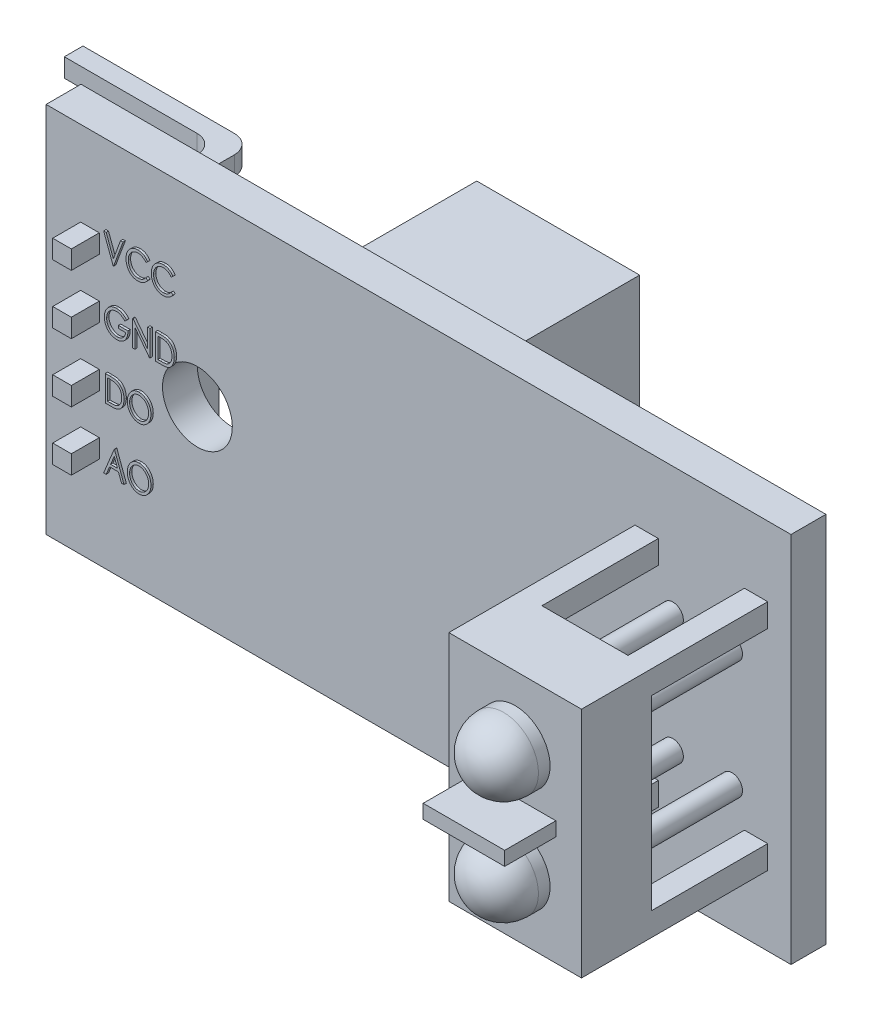
from build123d import *
from OCP.BRepFilletAPI import BRepFilletAPI_MakeChamfer

# Parameters (mm, degrees)
SKETCH_1_W            = 32
SKETCH_1_H            = 16
SKETCH_1_R            = 1.5
EXTRUDE_1_DEPTH       = 1.5
SKETCH_2_W            = 5.7
SKETCH_2_H            = 10
EXTRUDE_2_DEPTH       = 8
SKETCH_3_W            = 3.5
SKETCH_3_H            = 0.6
EXTRUDE_3_DEPTH       = 2.2
SKETCH_4_R            = 1.5
EXTRUDE_4_DEPTH       = 2
FILLET_1_R            = 1.5
SKETCH_5_W            = 3.7
SKETCH_5_H            = 5
CUT_EXTRUDE_1_DEPTH   = 37.467656903
SKETCH_7_W            = 5
SKETCH_7_H            = 8
CUT_EXTRUDE_2_DEPTH   = 37.795244258
SKETCH_8_W            = 7
SKETCH_8_H            = 7
EXTRUDE_5_DEPTH       = 5
SKETCH_9_R            = 1.6
CUT_EXTRUDE_3_DEPTH   = 0.1
CUT_EXTRUDE_4_DEPTH   = 1
SKETCH_11_W           = 2.5
SKETCH_11_H           = 10
EXTRUDE_6_DEPTH       = 2.8
SKETCH_12_W           = 0.8
SKETCH_12_H           = 0.8
EXTRUDE_7_DEPTH       = 2.3
SKETCH_13_W           = 0.8
SKETCH_13_H           = 0.8
EXTRUDE_8_DEPTH       = 6.5
FILLET_2_R            = 0.8
SKETCH_14_W           = 0.8
SKETCH_14_H           = 0.8
EXTRUDE_9_DEPTH       = 1.2
EXTRUDE_10_DEPTH      = 0.1
SKETCH_16_W           = 7
SKETCH_16_H           = 5
CUT_EXTRUDE_5_DEPTH   = 0.1
EXTRUDE_11_DEPTH      = 0.9
EXTRUDE_11_DEPTH_BACK = 8
SKETCH_17_R           = 0.45
SKETCH_18_W           = 4.5
SKETCH_18_H           = 5.5
EXTRUDE_12_DEPTH      = 1.6
SKETCH_19_W           = 2
SKETCH_19_H           = 0.5
EXTRUDE_13_DEPTH      = 1
CHAMFER_1_SIZE        = 0.5
CHAMFER_1_SIZE2       = 0.595876796
SKETCH_21_W           = 1
SKETCH_21_H           = 0.5
CUT_EXTRUDE_6_DEPTH   = 5
SKETCH_22_W           = 1
SKETCH_22_H           = 0.5
CUT_EXTRUDE_7_DEPTH   = 5
CHAMFER_2_SIZE        = 0.5
CHAMFER_2_SIZE2       = 0.595876796
CUT_EXTRUDE_8_DEPTH   = 0.1


with BuildPart() as part:
    # Эскиз1 → Бобышка-Вытянуть1 (new body)
    with BuildSketch(Plane.XY):
        with Locations((16, -8)):
            Rectangle(SKETCH_1_W, SKETCH_1_H)
        with Locations((6.5, -8)):
            Circle(SKETCH_1_R, mode=Mode.SUBTRACT)
    extrude(amount=EXTRUDE_1_DEPTH)

    # Эскиз2 → Бобышка-Вытянуть2 (add)
    with BuildSketch(Plane.XY.offset(1.5)):
        with Locations((28.15, -8)):
            Rectangle(SKETCH_2_W, SKETCH_2_H)
    extrude(amount=EXTRUDE_2_DEPTH)

    # Эскиз3 → Бобышка-Вытянуть3 (add)
    with BuildSketch(Plane.XY.offset(9.5)):
        with Locations((28.15, -8)):
            Rectangle(SKETCH_3_W, SKETCH_3_H)
    extrude(amount=EXTRUDE_3_DEPTH)

    # Эскиз4 → Бобышка-Вытянуть4 (add)
    with BuildSketch(Plane.XY.offset(9.5)):
        with Locations((28.15, -5.791093976)):
            Circle(SKETCH_4_R)
        with Locations((28.15, -10.291093976)):
            Circle(SKETCH_4_R)
    extrude(amount=EXTRUDE_4_DEPTH)

    # Скругление1
    fillet_1_edges = [part.edges().sort_by_distance(p)[0] for p in [
        (26.65, -5.791093976, 11.5),
        (26.65, -10.291093976, 11.5),
    ]]
    fillet(fillet_1_edges, radius=FILLET_1_R)

    # Эскиз5 → Вырез-Вытянуть1 (cut, through all)
    with BuildSketch(Plane.XZ.offset(13)):
        with Locations((28.15, 4)):
            Rectangle(SKETCH_5_W, SKETCH_5_H)
    extrude(amount=-CUT_EXTRUDE_1_DEPTH, mode=Mode.SUBTRACT)

    # Эскиз7 → Вырез-Вытянуть2 (cut, through all)
    with BuildSketch(Plane(origin=(31, 0, 0), x_dir=(0, 0, -1), z_dir=(1, 0, 0))):
        with Locations((-4, -8)):
            Rectangle(SKETCH_7_W, SKETCH_7_H)
    extrude(amount=-CUT_EXTRUDE_2_DEPTH, mode=Mode.SUBTRACT)

    # Эскиз8 → Бобышка-Вытянуть5 (add)
    with BuildSketch(Plane(origin=(0, 0, 0), x_dir=(-1, 0, 0), z_dir=(0, 0, -1))):
        with Locations((-15.5, -3.5)):
            Rectangle(SKETCH_8_W, SKETCH_8_H)
    extrude(amount=EXTRUDE_5_DEPTH)

    # Эскиз9 → Вырез-Вытянуть3 (cut)
    with BuildSketch(Plane(origin=(0, 0, -5), x_dir=(-1, 0, 0), z_dir=(0, 0, -1))):
        with Locations((-15.5, -3.5)):
            Circle(SKETCH_9_R)
    extrude(amount=-CUT_EXTRUDE_3_DEPTH, mode=Mode.SUBTRACT)

    # Эскиз10 → Вырез-Вытянуть4 (cut)
    with BuildSketch(Plane(origin=(0, 0, -4.9), x_dir=(-1, 0, 0), z_dir=(0, 0, -1))):
        with BuildLine():
            Line((-15.686190037, -3.301544425), (-17.087644603, -3.301544425))
            Line((-17.087644603, -3.301544425), (-17.087644603, -3.698455575))
            Line((-17.087644603, -3.698455575), (-15.686190037, -3.698455575))
            Line((-15.686190037, -3.698455575), (-15.686190037, -5.089129721))
            Line((-15.686190037, -5.089129721), (-15.313809963, -5.089129721))
            ThreePointArc((-15.313809963, -5.089129721), (-15.30767576, -5.088399001), (-15.301544425, -5.087644603))
            Line((-15.301544425, -5.087644603), (-15.301544425, -3.698455575))
            Line((-15.301544425, -3.698455575), (-13.912355397, -3.698455575))
            Line((-13.912355397, -3.698455575), (-13.912355397, -3.301544425))
            Line((-13.912355397, -3.301544425), (-15.301544425, -3.301544425))
            Line((-15.301544425, -3.301544425), (-15.301544425, -1.912355397))
            Line((-15.301544425, -1.912355397), (-15.686190037, -1.912355397))
            Line((-15.686190037, -1.912355397), (-15.686190037, -3.301544425))
        make_face()
    extrude(amount=-CUT_EXTRUDE_4_DEPTH, mode=Mode.SUBTRACT)

    # Эскиз11 → Бобышка-Вытянуть6 (add)
    with BuildSketch(Plane(origin=(0, 0, 0), x_dir=(-1, 0, 0), z_dir=(0, 0, -1))):
        with Locations((-1.88497668, -8)):
            Rectangle(SKETCH_11_W, SKETCH_11_H)
    extrude(amount=EXTRUDE_6_DEPTH)

    # Эскиз12 → Бобышка-Вытянуть7 (add)
    with BuildSketch(Plane(origin=(0, 0, -2.8), x_dir=(-1, 0, 0), z_dir=(0, 0, -1))):
        with Locations((-1.88497668, -4.035)):
            Rectangle(SKETCH_12_W, SKETCH_12_H)
        with Locations((-1.88497668, -6.575)):
            Rectangle(SKETCH_12_W, SKETCH_12_H)
        with Locations((-1.88497668, -9.115)):
            Rectangle(SKETCH_12_W, SKETCH_12_H)
        with Locations((-1.88497668, -11.655)):
            Rectangle(SKETCH_12_W, SKETCH_12_H)
    extrude(amount=EXTRUDE_7_DEPTH)

    # Эскиз13 → Бобышка-Вытянуть8 (add)
    with BuildSketch(Plane.ZY.offset(-1.48497668)):
        with Locations((-4.7, -4.035)):
            Rectangle(SKETCH_13_W, SKETCH_13_H)
        with Locations((-4.7, -6.575)):
            Rectangle(SKETCH_13_W, SKETCH_13_H)
        with Locations((-4.7, -9.115)):
            Rectangle(SKETCH_13_W, SKETCH_13_H)
        with Locations((-4.7, -11.655)):
            Rectangle(SKETCH_13_W, SKETCH_13_H)
    extrude(amount=EXTRUDE_8_DEPTH)

    # Скругление2
    fillet_2_edges = [part.edges().sort_by_distance(p)[0] for p in [
        (1.48497668, -4.035, -4.3),
        (1.48497668, -6.575, -4.3),
        (1.48497668, -9.115, -4.3),
        (1.48497668, -11.655, -4.3),
        (2.28497668, -11.655, -5.1),
        (2.28497668, -9.115, -5.1),
        (2.28497668, -6.575, -5.1),
        (2.28497668, -4.035, -5.1),
    ]]
    fillet(fillet_2_edges, radius=FILLET_2_R)

    # Эскиз14 → Бобышка-Вытянуть9 (add)
    with BuildSketch(Plane.XY.offset(1.5)):
        with Locations((1.88497668, -11.655)):
            Rectangle(SKETCH_14_W, SKETCH_14_H)
        with Locations((1.88497668, -9.115)):
            Rectangle(SKETCH_14_W, SKETCH_14_H)
        with Locations((1.88497668, -6.575)):
            Rectangle(SKETCH_14_W, SKETCH_14_H)
        with Locations((1.88497668, -4.035)):
            Rectangle(SKETCH_14_W, SKETCH_14_H)
    extrude(amount=EXTRUDE_9_DEPTH)

    # Эскиз15 → Бобышка-Вытянуть10 (add)
    # profile 1 of 10: a face of its own
    with BuildSketch(Plane.XY.offset(1.5)):
        Polygon((2.573756052, -3.37014454), (2.680847398, -3.37014454), (2.989781693, -4.201314412), (3.298715988, -3.37014454), (3.405807334, -3.37014454), (2.996832975, -4.47014454), (2.982730411, -4.47014454), align=None)
    # profile 2 of 10: a face of its own
    with BuildSketch(Plane.XY.offset(1.5)):
        with BuildLine():
            Line((4.463499642, -3.571987489), (4.387478007, -3.638093258))
            add(Edge.make_bspline(
                [(4.387478007, -3.638093258), (4.376921013, -3.623736305), (4.356200585, -3.595557616), (4.320243232, -3.558282002), (4.280897654, -3.526743502), (4.238682044, -3.500696045), (4.193987351, -3.479943593), (4.146833646, -3.465473926), (4.097559209, -3.456272496), (4.063894728, -3.455269074), (4.046812943, -3.454759925)],
                knots=[0, 0, 0, 0, 1.060001202, 2.080486181, 3.072710802, 4.054397061, 5.026768566, 5.997634721, 6.983974445, 8, 8, 8, 8], degree=3))
            add(Edge.make_bspline(
                [(4.046812943, -3.454759925), (4.037401242, -3.454886462), (4.018672434, -3.455138264), (3.990865517, -3.458483555), (3.963521348, -3.463198521), (3.936767349, -3.470039775), (3.910648837, -3.479051988), (3.884792706, -3.489434448), (3.85974289, -3.502387775), (3.835249752, -3.516864709), (3.811810575, -3.533130789), (3.789509961, -3.550791615), (3.768511406, -3.569696167), (3.749101382, -3.590175347), (3.730745314, -3.611666031), (3.713923096, -3.634749683), (3.698605052, -3.659194298), (3.684446587, -3.684743946), (3.671892458, -3.711373403), (3.661118172, -3.738920426), (3.652029863, -3.767339361), (3.644618725, -3.796568739), (3.638602133, -3.826559386), (3.634414424, -3.857392465), (3.632007377, -3.889035947), (3.631635818, -3.910445006), (3.63144836, -3.921246303)],
                knots=[0, 0, 0, 0, 0.972857666, 1.935937621, 2.892644668, 3.84153827, 4.78805697, 5.748767056, 6.720437586, 7.701476752, 8.689783408, 9.668584638, 10.642064971, 11.609211095, 12.58482327, 13.563359142, 14.560270548, 15.566717031, 16.582807908, 17.60275364, 18.623802123, 19.666660784, 20.719981331, 21.78574766, 22.882865563, 24, 24, 24, 24], degree=3))
            add(Edge.make_bspline(
                [(3.63144836, -3.921246303), (3.631726589, -3.93749928), (3.632272293, -3.969376936), (3.638346326, -4.016071675), (3.647302385, -4.060785782), (3.660813749, -4.103315682), (3.677411642, -4.144007499), (3.698105009, -4.182562816), (3.722393691, -4.219061551), (3.750287036, -4.253028039), (3.780966287, -4.28395358), (3.813791332, -4.311302981), (3.848944875, -4.334101555), (3.885840086, -4.352936281), (3.924768007, -4.367674235), (3.965682711, -4.377818102), (4.008468166, -4.38457543), (4.037678444, -4.385207518), (4.05254211, -4.385529156)],
                knots=[0, 0, 0, 0, 1.112867388, 2.18271418, 3.220979641, 4.233260885, 5.235081073, 6.227925254, 7.225857715, 8.234253895, 9.234163767, 10.206453678, 11.155586583, 12.098576256, 13.039778371, 14.000328891, 14.982466338, 16, 16, 16, 16], degree=3))
            add(Edge.make_bspline(
                [(4.05254211, -4.385529156), (4.068885443, -4.384988427), (4.101215259, -4.383918776), (4.148561166, -4.375113476), (4.193843595, -4.360622313), (4.237065091, -4.340486143), (4.278137043, -4.314285579), (4.31725565, -4.282681192), (4.354122937, -4.245042357), (4.376147682, -4.216750286), (4.387478007, -4.202195822)],
                knots=[0, 0, 0, 0, 0.986957261, 1.952364667, 2.898367664, 3.853405679, 4.824884281, 5.834775651, 6.886130321, 8, 8, 8, 8], degree=3))
            Line((4.387478007, -4.202195822), (4.463499642, -4.267640534))
            add(Edge.make_bspline(
                [(4.463499642, -4.267640534), (4.457510622, -4.276604483), (4.445586233, -4.294452082), (4.4259783, -4.319610963), (4.405430006, -4.343342979), (4.383716601, -4.36548931), (4.360916215, -4.386104241), (4.336976037, -4.405241934), (4.311847448, -4.422528042), (4.285830135, -4.438526334), (4.258799388, -4.452576499), (4.23093252, -4.464692885), (4.202392172, -4.475107285), (4.173049337, -4.483749085), (4.142853423, -4.49034851), (4.111851441, -4.494894357), (4.080146208, -4.497913892), (4.058719002, -4.498203592), (4.047914706, -4.498349668)],
                knots=[0, 0, 0, 0, 1.041298738, 2.073269614, 3.079343203, 4.072975442, 5.067823381, 6.04757226, 7.031859828, 8.012841613, 8.996822134, 9.972475884, 10.946812456, 11.930409035, 12.925687179, 13.930333091, 14.956406453, 16, 16, 16, 16], degree=3))
            add(Edge.make_bspline(
                [(4.047914706, -4.498349668), (4.037625471, -4.498268222), (4.017310641, -4.498107417), (3.987322586, -4.495462787), (3.958098483, -4.491851645), (3.929738648, -4.486459292), (3.902058687, -4.480030415), (3.875381114, -4.471437882), (3.849377631, -4.46193299), (3.824339454, -4.450528192), (3.800084885, -4.437805662), (3.776649176, -4.423382308), (3.754012723, -4.407531899), (3.732094243, -4.390321145), (3.711135559, -4.371535853), (3.691061618, -4.351215855), (3.67181721, -4.329334362), (3.659793534, -4.313832848), (3.653703969, -4.30598188)],
                knots=[0, 0, 0, 0, 1.082168949, 2.13660973, 3.165131306, 4.179150287, 5.172582136, 6.152699036, 7.125936765, 8.084022289, 9.045033083, 10.005950655, 10.977130504, 11.951134984, 12.93626608, 13.936288924, 14.954803513, 16, 16, 16, 16], degree=3))
            add(Edge.make_bspline(
                [(3.653703969, -4.30598188), (3.643948401, -4.292278636), (3.624478339, -4.264929843), (3.600287987, -4.220677991), (3.579055511, -4.174792645), (3.562204514, -4.126552308), (3.548921022, -4.076311197), (3.539467372, -4.024004717), (3.533938542, -3.969549447), (3.533137835, -3.932570391), (3.532730411, -3.913754316)],
                knots=[0, 0, 0, 0, 0.965695679, 1.927325409, 2.892347695, 3.868051992, 4.858934661, 5.8754491, 6.918963493, 8, 8, 8, 8], degree=3))
            add(Edge.make_bspline(
                [(3.532730411, -3.913754316), (3.533097402, -3.89397309), (3.53381883, -3.855087358), (3.541177353, -3.798045753), (3.552564066, -3.743417595), (3.568332717, -3.691069372), (3.589319618, -3.641326859), (3.614345205, -3.593733261), (3.644430214, -3.548770173), (3.678528049, -3.506535415), (3.716080394, -3.468008758), (3.756345267, -3.434147586), (3.799210597, -3.405879477), (3.844065855, -3.382276406), (3.89138949, -3.364055627), (3.941094616, -3.351374971), (3.993086094, -3.343440469), (4.028568454, -3.342445056), (4.04659259, -3.341939412)],
                knots=[0, 0, 0, 0, 1.106112667, 2.174385052, 3.211582004, 4.225457265, 5.227447083, 6.227412712, 7.229175014, 8.248903795, 9.260110958, 10.234480102, 11.186099419, 12.127120276, 13.064977847, 14.015771749, 14.992062505, 16, 16, 16, 16], degree=3))
            add(Edge.make_bspline(
                [(4.04659259, -3.341939412), (4.057542813, -3.342091851), (4.079261356, -3.342394197), (4.111430355, -3.345322706), (4.142835206, -3.35021244), (4.173443949, -3.356823337), (4.203347988, -3.365079179), (4.232198866, -3.375790874), (4.260290533, -3.388186097), (4.287591462, -3.402195499), (4.313791017, -3.418145689), (4.338968702, -3.435479443), (4.362730142, -3.454583731), (4.385628371, -3.474790236), (4.406875152, -3.496903151), (4.427107338, -3.520386742), (4.44600577, -3.545477485), (4.457641666, -3.563110382), (4.463499642, -3.571987489)],
                knots=[0, 0, 0, 0, 1.05516527, 2.092802295, 3.110026713, 4.116678098, 5.109494449, 6.097148809, 7.079716065, 8.067547999, 9.05215325, 10.03400621, 11.011331707, 11.988990442, 12.975223058, 13.964195778, 14.975094603, 16, 16, 16, 16], degree=3))
        make_face()
    # profile 3 of 10: a face of its own
    with BuildSketch(Plane.XY.offset(1.5)):
        with BuildLine():
            Line((5.549397078, -3.571987489), (5.473375443, -3.638093258))
            add(Edge.make_bspline(
                [(5.473375443, -3.638093258), (5.462818449, -3.623736305), (5.44209802, -3.595557616), (5.406140668, -3.558282002), (5.36679509, -3.526743502), (5.324579479, -3.500696045), (5.279884787, -3.479943593), (5.232731082, -3.465473926), (5.183456645, -3.456272496), (5.149792164, -3.455269074), (5.132710379, -3.454759925)],
                knots=[0, 0, 0, 0, 1.060001202, 2.080486181, 3.072710802, 4.054397061, 5.026768566, 5.997634721, 6.983974445, 8, 8, 8, 8], degree=3))
            add(Edge.make_bspline(
                [(5.132710379, -3.454759925), (5.123298678, -3.454886462), (5.10456987, -3.455138264), (5.076762953, -3.458483555), (5.049418784, -3.463198521), (5.022664785, -3.470039775), (4.996546273, -3.479051988), (4.970690142, -3.489434448), (4.945640325, -3.502387775), (4.921147188, -3.516864709), (4.897708011, -3.533130789), (4.875407397, -3.550791615), (4.854408842, -3.569696167), (4.834998818, -3.590175347), (4.81664275, -3.611666031), (4.799820531, -3.634749683), (4.784502488, -3.659194298), (4.770344023, -3.684743946), (4.757789894, -3.711373403), (4.747015608, -3.738920426), (4.737927299, -3.767339361), (4.73051616, -3.796568739), (4.724499569, -3.826559386), (4.72031186, -3.857392465), (4.717904813, -3.889035947), (4.717533254, -3.910445006), (4.717345795, -3.921246303)],
                knots=[0, 0, 0, 0, 0.972857666, 1.935937621, 2.892644668, 3.84153827, 4.78805697, 5.748767056, 6.720437586, 7.701476752, 8.689783408, 9.668584638, 10.642064971, 11.609211095, 12.58482327, 13.563359142, 14.560270548, 15.566717031, 16.582807908, 17.60275364, 18.623802123, 19.666660784, 20.719981331, 21.78574766, 22.882865563, 24, 24, 24, 24], degree=3))
            add(Edge.make_bspline(
                [(4.717345795, -3.921246303), (4.717624025, -3.93749928), (4.718169729, -3.969376936), (4.724243761, -4.016071675), (4.73319982, -4.060785782), (4.746711185, -4.103315682), (4.763309078, -4.144007499), (4.784002445, -4.182562816), (4.808291127, -4.219061551), (4.836184472, -4.253028039), (4.866863723, -4.28395358), (4.899688768, -4.311302981), (4.93484231, -4.334101555), (4.971737522, -4.352936281), (5.010665443, -4.367674235), (5.051580147, -4.377818102), (5.094365602, -4.38457543), (5.12357588, -4.385207518), (5.138439545, -4.385529156)],
                knots=[0, 0, 0, 0, 1.112867388, 2.18271418, 3.220979641, 4.233260885, 5.235081073, 6.227925254, 7.225857715, 8.234253895, 9.234163767, 10.206453678, 11.155586583, 12.098576256, 13.039778371, 14.000328891, 14.982466338, 16, 16, 16, 16], degree=3))
            add(Edge.make_bspline(
                [(5.138439545, -4.385529156), (5.154782879, -4.384988427), (5.187112694, -4.383918776), (5.234458602, -4.375113476), (5.279741031, -4.360622313), (5.322962527, -4.340486143), (5.364034478, -4.314285579), (5.403153086, -4.282681192), (5.440020373, -4.245042357), (5.462045118, -4.216750286), (5.473375443, -4.202195822)],
                knots=[0, 0, 0, 0, 0.986957261, 1.952364667, 2.898367664, 3.853405679, 4.824884281, 5.834775651, 6.886130321, 8, 8, 8, 8], degree=3))
            Line((5.473375443, -4.202195822), (5.549397078, -4.267640534))
            add(Edge.make_bspline(
                [(5.549397078, -4.267640534), (5.543408058, -4.276604483), (5.531483669, -4.294452082), (5.511875736, -4.319610963), (5.491327441, -4.343342979), (5.469614037, -4.36548931), (5.44681365, -4.386104241), (5.422873473, -4.405241934), (5.397744884, -4.422528042), (5.371727571, -4.438526334), (5.344696824, -4.452576499), (5.316829956, -4.464692885), (5.288289608, -4.475107285), (5.258946773, -4.483749085), (5.228750859, -4.49034851), (5.197748877, -4.494894357), (5.166043644, -4.497913892), (5.144616438, -4.498203592), (5.133812142, -4.498349668)],
                knots=[0, 0, 0, 0, 1.041298738, 2.073269614, 3.079343203, 4.072975442, 5.067823381, 6.04757226, 7.031859828, 8.012841613, 8.996822134, 9.972475884, 10.946812456, 11.930409035, 12.925687179, 13.930333091, 14.956406453, 16, 16, 16, 16], degree=3))
            add(Edge.make_bspline(
                [(5.133812142, -4.498349668), (5.123522907, -4.498268222), (5.103208077, -4.498107417), (5.073220022, -4.495462787), (5.043995919, -4.491851645), (5.015636084, -4.486459292), (4.987956122, -4.480030415), (4.96127855, -4.471437882), (4.935275067, -4.46193299), (4.910236889, -4.450528192), (4.88598232, -4.437805662), (4.862546611, -4.423382308), (4.839910158, -4.407531899), (4.817991679, -4.390321145), (4.797032995, -4.371535853), (4.776959054, -4.351215855), (4.757714646, -4.329334362), (4.74569097, -4.313832848), (4.739601404, -4.30598188)],
                knots=[0, 0, 0, 0, 1.082168949, 2.13660973, 3.165131306, 4.179150287, 5.172582136, 6.152699036, 7.125936765, 8.084022289, 9.045033083, 10.005950655, 10.977130504, 11.951134984, 12.93626608, 13.936288924, 14.954803513, 16, 16, 16, 16], degree=3))
            add(Edge.make_bspline(
                [(4.739601404, -4.30598188), (4.729845836, -4.292278636), (4.710375775, -4.264929843), (4.686185423, -4.220677991), (4.664952947, -4.174792645), (4.64810195, -4.126552308), (4.634818458, -4.076311197), (4.625364808, -4.024004717), (4.619835978, -3.969549447), (4.619035271, -3.932570391), (4.618627847, -3.913754316)],
                knots=[0, 0, 0, 0, 0.965695679, 1.927325409, 2.892347695, 3.868051992, 4.858934661, 5.8754491, 6.918963493, 8, 8, 8, 8], degree=3))
            add(Edge.make_bspline(
                [(4.618627847, -3.913754316), (4.618994838, -3.89397309), (4.619716266, -3.855087358), (4.627074789, -3.798045753), (4.638461502, -3.743417595), (4.654230153, -3.691069372), (4.675217054, -3.641326859), (4.700242641, -3.593733261), (4.73032765, -3.548770173), (4.764425485, -3.506535415), (4.80197783, -3.468008758), (4.842242703, -3.434147586), (4.885108033, -3.405879477), (4.929963291, -3.382276406), (4.977286926, -3.364055627), (5.026992052, -3.351374971), (5.07898353, -3.343440469), (5.11446589, -3.342445056), (5.132490026, -3.341939412)],
                knots=[0, 0, 0, 0, 1.106112667, 2.174385052, 3.211582004, 4.225457265, 5.227447083, 6.227412712, 7.229175014, 8.248903795, 9.260110958, 10.234480102, 11.186099419, 12.127120276, 13.064977847, 14.015771749, 14.992062505, 16, 16, 16, 16], degree=3))
            add(Edge.make_bspline(
                [(5.132490026, -3.341939412), (5.143440249, -3.342091851), (5.165158792, -3.342394197), (5.19732779, -3.345322706), (5.228732642, -3.35021244), (5.259341385, -3.356823337), (5.289245424, -3.365079179), (5.318096302, -3.375790874), (5.346187969, -3.388186097), (5.373488898, -3.402195499), (5.399688453, -3.418145689), (5.424866138, -3.435479443), (5.448627578, -3.454583731), (5.471525807, -3.474790236), (5.492772588, -3.496903151), (5.513004774, -3.520386742), (5.531903206, -3.545477485), (5.543539101, -3.563110382), (5.549397078, -3.571987489)],
                knots=[0, 0, 0, 0, 1.05516527, 2.092802295, 3.110026713, 4.116678098, 5.109494449, 6.097148809, 7.079716065, 8.067547999, 9.05215325, 10.03400621, 11.011331707, 11.988990442, 12.975223058, 13.964195778, 14.975094603, 16, 16, 16, 16], degree=3))
        make_face()
    # profile 4 of 10: a face of its own
    with BuildSketch(Plane.XY.offset(1.5)):
        with BuildLine():
            Line((3.560935539, -6.191218258), (3.486456372, -6.271426591))
            add(Edge.make_bspline(
                [(3.486456372, -6.271426591), (3.473124666, -6.257066291), (3.446960927, -6.228883918), (3.404039674, -6.191746555), (3.359065122, -6.160273388), (3.31265058, -6.134328896), (3.265722718, -6.113762564), (3.218948172, -6.09916666), (3.172759515, -6.089737796), (3.142014805, -6.088636697), (3.126840988, -6.088093258)],
                knots=[0, 0, 0, 0, 1.131335406, 2.220268106, 3.271452375, 4.297255123, 5.287332592, 6.225418144, 7.124168701, 8, 8, 8, 8], degree=3))
            add(Edge.make_bspline(
                [(3.126840988, -6.088093258), (3.117576319, -6.088222794), (3.099067701, -6.088481575), (3.071552744, -6.091811385), (3.04429211, -6.096577308), (3.017404855, -6.103423873), (2.990842717, -6.112314253), (2.964614136, -6.123095861), (2.938733315, -6.135974499), (2.91338689, -6.150680607), (2.888720695, -6.166799895), (2.865602176, -6.184807003), (2.843643235, -6.203909013), (2.823400552, -6.224757145), (2.804413427, -6.246830438), (2.786671588, -6.270209978), (2.770632998, -6.29515568), (2.75613661, -6.321327678), (2.743316841, -6.348339135), (2.731575662, -6.375695547), (2.72234714, -6.403728213), (2.714202127, -6.431884903), (2.708353873, -6.460573815), (2.703915467, -6.48953889), (2.701181394, -6.518977088), (2.70084718, -6.538708579), (2.700679129, -6.548630117)],
                knots=[0, 0, 0, 0, 0.957531822, 1.912922289, 2.862011677, 3.818126519, 4.778906464, 5.756414481, 6.748306359, 7.765809291, 8.7854363, 9.792709949, 10.793778567, 11.792828027, 12.794645581, 13.803350139, 14.825181505, 15.858773772, 16.894958351, 17.916281442, 18.934719513, 19.944681594, 20.945750212, 21.959816919, 22.974139614, 24, 24, 24, 24], degree=3))
            add(Edge.make_bspline(
                [(2.700679129, -6.548630117), (2.700821966, -6.558774613), (2.701107184, -6.579031086), (2.704233351, -6.609167587), (2.708431978, -6.639020159), (2.715003477, -6.668409473), (2.723018432, -6.69754424), (2.733336329, -6.726132011), (2.744896896, -6.754503387), (2.75862703, -6.782079861), (2.773622908, -6.808932109), (2.790530533, -6.834269299), (2.808445244, -6.858340352), (2.828122128, -6.880722293), (2.848855761, -6.901879216), (2.871326727, -6.921281734), (2.894876, -6.939409083), (2.919745203, -6.955936605), (2.945734589, -6.970585542), (2.972335711, -6.983732692), (2.999733591, -6.994464981), (3.027717544, -7.003313882), (3.056239727, -7.010472045), (3.085448483, -7.015122734), (3.115156589, -7.018504076), (3.13520439, -7.01874205), (3.145350603, -7.018862489)],
                knots=[0, 0, 0, 0, 1.014396523, 2.02554134, 3.028295436, 4.028488902, 5.035755334, 6.048980313, 7.066909895, 8.098719958, 9.128566039, 10.141391319, 11.143606878, 12.127885461, 13.120248603, 14.104527185, 15.095038902, 16.091555175, 17.088585988, 18.077706861, 19.057367231, 20.028698393, 21.012400885, 21.995664224, 22.985603477, 24, 24, 24, 24], degree=3))
            add(Edge.make_bspline(
                [(3.145350603, -7.018862489), (3.157484234, -7.018561662), (3.181391817, -7.017968926), (3.216553356, -7.013411347), (3.250386415, -7.00627969), (3.282685967, -6.995835284), (3.313499157, -6.982509167), (3.34297766, -6.966446119), (3.370806883, -6.947053703), (3.397169842, -6.925124542), (3.421505709, -6.900780197), (3.443442869, -6.874468141), (3.462620688, -6.846389577), (3.479338587, -6.816655015), (3.493159669, -6.785098165), (3.504392118, -6.751755123), (3.513394556, -6.716799221), (3.516868678, -6.692636217), (3.518627847, -6.68040095)],
                knots=[0, 0, 0, 0, 1.051129639, 2.071100652, 3.067302124, 4.04351983, 5.007123942, 5.972764852, 6.947321263, 7.941528173, 8.940653207, 9.925896293, 10.905696917, 11.883075849, 12.877649407, 13.886036726, 14.929565851, 16, 16, 16, 16], degree=3))
            Line((3.518627847, -6.68040095), (3.208371437, -6.68040095))
            Line((3.208371437, -6.68040095), (3.208371437, -6.567580438))
            Line((3.208371437, -6.567580438), (3.617345795, -6.567580438))
            add(Edge.make_bspline(
                [(3.617345795, -6.567580438), (3.616811673, -6.58860184), (3.615767266, -6.629706426), (3.609635308, -6.68968476), (3.599385032, -6.746388801), (3.584736188, -6.799629344), (3.566569865, -6.849760713), (3.544041623, -6.8964202), (3.517376385, -6.939694221), (3.487136769, -6.979500219), (3.453396058, -7.015275708), (3.416687356, -7.046598784), (3.377013987, -7.072970162), (3.334590645, -7.094427268), (3.289547295, -7.111346821), (3.241700107, -7.123134708), (3.191108479, -7.13032293), (3.156465984, -7.131222637), (3.138740026, -7.131683002)],
                knots=[0, 0, 0, 0, 1.210777789, 2.367516602, 3.468589441, 4.525646522, 5.54414491, 6.535575829, 7.504180693, 8.467040959, 9.40969031, 10.331064482, 11.240365786, 12.146591654, 13.063565696, 14.005445851, 14.979421581, 16, 16, 16, 16], degree=3))
            add(Edge.make_bspline(
                [(3.138740026, -7.131683002), (3.127864387, -7.131503888), (3.106380091, -7.131150057), (3.074612397, -7.128634759), (3.043686876, -7.124792757), (3.013633286, -7.118930074), (2.984358725, -7.111820833), (2.956071551, -7.102674931), (2.928646712, -7.092044774), (2.901931443, -7.079990714), (2.876185416, -7.066107783), (2.85140259, -7.050520039), (2.827289172, -7.033619747), (2.804212165, -7.014798183), (2.781817289, -6.994521125), (2.760540543, -6.97233124), (2.739702688, -6.948924091), (2.726940764, -6.932131085), (2.72051086, -6.923670181)],
                knots=[0, 0, 0, 0, 1.073875762, 2.121389401, 3.145205683, 4.149514963, 5.14345099, 6.118334554, 7.082773847, 8.046831216, 9.010670274, 9.968651073, 10.936629604, 11.916492246, 12.907433166, 13.917930903, 14.950980736, 16, 16, 16, 16], degree=3))
            add(Edge.make_bspline(
                [(2.72051086, -6.923670181), (2.711001018, -6.910244814), (2.692073941, -6.883524812), (2.668339381, -6.840736973), (2.647467486, -6.796807643), (2.631119763, -6.750957705), (2.617952362, -6.703707866), (2.60887714, -6.654817066), (2.602816722, -6.604458508), (2.602248667, -6.57031622), (2.60196118, -6.553037168)],
                knots=[0, 0, 0, 0, 0.996546363, 1.983388519, 2.961352749, 3.941584443, 4.929901843, 5.931448132, 6.953127772, 8, 8, 8, 8], degree=3))
            add(Edge.make_bspline(
                [(2.60196118, -6.553037168), (2.602188923, -6.540103943), (2.602641169, -6.514421531), (2.605776293, -6.476231631), (2.610996788, -6.438764161), (2.618640057, -6.402021266), (2.627972521, -6.365907842), (2.639783718, -6.330469634), (2.653633194, -6.295750803), (2.669479508, -6.261808751), (2.687181881, -6.229189308), (2.706642695, -6.198222571), (2.727625148, -6.169088366), (2.750042506, -6.141610498), (2.774427865, -6.116360475), (2.800038566, -6.092569518), (2.827367518, -6.070773316), (2.856276493, -6.050964568), (2.886337298, -6.033128729), (2.917487143, -6.017642259), (2.949633262, -6.00463606), (2.98263259, -5.993723454), (3.016801586, -5.985649104), (3.051838546, -5.979763945), (3.087820327, -5.975771779), (3.112140028, -5.975440156), (3.12441711, -5.975272745)],
                knots=[0, 0, 0, 0, 1.07164269, 2.128036097, 3.172988306, 4.204309344, 5.236222884, 6.262087682, 7.297370218, 8.332062181, 9.364280816, 10.37073307, 11.360577134, 12.33782248, 13.306405567, 14.266923389, 15.232672116, 16.200030553, 17.16870925, 18.126832918, 19.079625504, 20.040066188, 21.004048815, 21.985643799, 22.983111838, 24, 24, 24, 24], degree=3))
            add(Edge.make_bspline(
                [(3.12441711, -5.975272745), (3.134410983, -5.975458991), (3.15435382, -5.975830646), (3.18400098, -5.978300029), (3.213266062, -5.982309796), (3.242075114, -5.987700655), (3.270365406, -5.995076575), (3.298222383, -6.003951828), (3.325749698, -6.014183003), (3.352772582, -6.026457503), (3.379466341, -6.040371384), (3.406004323, -6.056027246), (3.432267365, -6.073787231), (3.458486203, -6.093371263), (3.484505082, -6.115013775), (3.510216394, -6.138641182), (3.535913063, -6.16403586), (3.552487636, -6.182041138), (3.560935539, -6.191218258)],
                knots=[0, 0, 0, 0, 0.953642326, 1.902999293, 2.83675562, 3.771511039, 4.698004985, 5.624578465, 6.56059437, 7.498576395, 8.454739615, 9.432017672, 10.437052158, 11.478597186, 12.553703354, 13.664985171, 14.809864987, 16, 16, 16, 16], degree=3))
        make_face()
    # profile 5 of 10: a face of its own
    with BuildSketch(Plane.XY.offset(1.5)):
        Polygon((3.814781693, -7.103477874), (3.814781693, -6.003477874), (3.835494834, -6.003477874), (4.463499642, -6.827376111), (4.463499642, -6.003477874), (4.56221759, -6.003477874), (4.56221759, -7.103477874), (4.539741629, -7.103477874), (3.913499642, -6.282003515), (3.913499642, -7.103477874), align=None)
    # profile 6 of 10: a face of its own
    with BuildSketch(Plane.XY.offset(1.5)):
        with BuildLine():
            Line((4.80196118, -7.103477874), (4.80196118, -6.003477874))
            Line((4.80196118, -6.003477874), (4.999837783, -6.003477874))
            add(Edge.make_bspline(
                [(4.999837783, -6.003477874), (5.017100134, -6.003616341), (5.050385543, -6.003883336), (5.098447777, -6.005588471), (5.142845446, -6.008607658), (5.183489547, -6.012986586), (5.220571842, -6.018421105), (5.253929034, -6.025117323), (5.283714007, -6.033146702), (5.301910484, -6.039927502), (5.310534898, -6.043141335)],
                knots=[0, 0, 0, 0, 1.315724667, 2.53699131, 3.664990376, 4.706723947, 5.652070057, 6.520539819, 7.298794104, 8, 8, 8, 8], degree=3))
            add(Edge.make_bspline(
                [(5.310534898, -6.043141335), (5.321867756, -6.048010761), (5.344415383, -6.057698875), (5.376405191, -6.075690527), (5.406432308, -6.096253812), (5.434697614, -6.11930063), (5.460763242, -6.145136009), (5.485289231, -6.17331967), (5.507657631, -6.204205661), (5.528167234, -6.2374825), (5.546339065, -6.272883102), (5.562293709, -6.310048163), (5.575684754, -6.348879027), (5.586743753, -6.38936014), (5.595293129, -6.431544913), (5.601481014, -6.475392947), (5.604953092, -6.520882904), (5.605519678, -6.551709434), (5.605807334, -6.567360085)],
                knots=[0, 0, 0, 0, 0.924800359, 1.839964368, 2.747783831, 3.652252776, 4.571785451, 5.497553767, 6.451983905, 7.429142128, 8.427204497, 9.434321214, 10.460683131, 11.505979534, 12.580111876, 13.687410116, 14.825896436, 16, 16, 16, 16], degree=3))
            add(Edge.make_bspline(
                [(5.605807334, -6.567360085), (5.605683045, -6.580955186), (5.605438159, -6.607741554), (5.602157628, -6.647225341), (5.597321561, -6.685456913), (5.590895494, -6.722533423), (5.581892728, -6.758291549), (5.571440921, -6.792935373), (5.55886262, -6.826290136), (5.544280229, -6.858155745), (5.528348148, -6.888420604), (5.510988605, -6.916727649), (5.49295353, -6.943276734), (5.473047465, -6.96732474), (5.452489126, -6.989676995), (5.430526501, -7.009778989), (5.407532524, -7.027982847), (5.383117206, -7.044220046), (5.356844334, -7.058493766), (5.328213294, -7.070645952), (5.297107916, -7.080615776), (5.263622657, -7.089019666), (5.227639358, -7.095638068), (5.189135004, -7.100066521), (5.148183052, -7.103083265), (5.120082712, -7.103343708), (5.105607013, -7.103477874)],
                knots=[0, 0, 0, 0, 1.170566915, 2.306362916, 3.409558859, 4.489123214, 5.544697587, 6.583245604, 7.604248301, 8.612055345, 9.599647246, 10.547858778, 11.470856558, 12.361035986, 13.233851144, 14.084492039, 14.922287147, 15.757427099, 16.606608392, 17.49372568, 18.431945823, 19.416941035, 20.465383131, 21.580359581, 22.753538819, 24, 24, 24, 24], degree=3))
            Line((5.105607013, -7.103477874), (4.80196118, -7.103477874))
        make_face()
        with BuildLine():
            Line((4.900679129, -6.990657361), (5.009312943, -6.990657361))
            add(Edge.make_bspline(
                [(5.009312943, -6.990657361), (5.024958984, -6.990580879), (5.054935012, -6.990434347), (5.098063523, -6.98910734), (5.137449703, -6.986958946), (5.17317633, -6.983962049), (5.205137742, -6.979965735), (5.233428858, -6.975523472), (5.258001764, -6.969974465), (5.272813575, -6.964986677), (5.279685539, -6.962672585)],
                knots=[0, 0, 0, 0, 1.375935935, 2.63613619, 3.794191116, 4.844531808, 5.788349761, 6.626220458, 7.362632744, 8, 8, 8, 8], degree=3))
            add(Edge.make_bspline(
                [(5.279685539, -6.962672585), (5.288335746, -6.959128874), (5.305500446, -6.95209705), (5.330117759, -6.939333668), (5.353003666, -6.924148983), (5.37483134, -6.90747247), (5.394865945, -6.888320834), (5.413599872, -6.867411666), (5.430937942, -6.844502237), (5.446701258, -6.81962818), (5.461002672, -6.793083485), (5.47336867, -6.765006983), (5.483704951, -6.735511261), (5.492368108, -6.704620463), (5.498847114, -6.672187965), (5.503733936, -6.638435296), (5.506653655, -6.603256057), (5.506942216, -6.579338108), (5.507089385, -6.567139733)],
                knots=[0, 0, 0, 0, 0.921437272, 1.828417929, 2.728287179, 3.626406277, 4.533155606, 5.456327229, 6.391997779, 7.362338549, 8.357046705, 9.362218445, 10.383770442, 11.436248382, 12.522758724, 13.64217368, 14.797486672, 16, 16, 16, 16], degree=3))
            add(Edge.make_bspline(
                [(5.507089385, -6.567139733), (5.506871415, -6.554279171), (5.506443553, -6.529034729), (5.503270931, -6.491956778), (5.498313442, -6.456308972), (5.49097204, -6.422102796), (5.481770823, -6.389252147), (5.470523919, -6.357767422), (5.457071164, -6.327803677), (5.441638491, -6.299395868), (5.424553514, -6.27269111), (5.405549277, -6.248176667), (5.384914375, -6.225846959), (5.362949528, -6.205367194), (5.338900819, -6.187584572), (5.313606219, -6.17158503), (5.286468254, -6.158033222), (5.267485907, -6.150807729), (5.257870635, -6.147147745)],
                knots=[0, 0, 0, 0, 1.181456899, 2.31912264, 3.416650319, 4.486100574, 5.530800009, 6.549007929, 7.554886024, 8.545342906, 9.516858806, 10.464454463, 11.390981978, 12.307973961, 13.219011793, 14.134637004, 15.055123625, 16, 16, 16, 16], degree=3))
            add(Edge.make_bspline(
                [(5.257870635, -6.147147745), (5.249973075, -6.144596696), (5.233185399, -6.139173984), (5.205635255, -6.133271296), (5.17460714, -6.128029725), (5.13998672, -6.123629033), (5.101825702, -6.120451409), (5.060164801, -6.118071983), (5.01490773, -6.116462823), (4.983533183, -6.116354625), (4.967225603, -6.116298386)],
                knots=[0, 0, 0, 0, 0.678535917, 1.442349433, 2.301734165, 3.252693306, 4.296065182, 5.433594972, 6.666057041, 8, 8, 8, 8], degree=3))
            Line((4.967225603, -6.116298386), (4.900679129, -6.116298386))
            Line((4.900679129, -6.116298386), (4.900679129, -6.990657361))
        make_face(mode=Mode.SUBTRACT)
    # profile 7 of 10: a face of its own
    with BuildSketch(Plane.XY.offset(1.5)):
        with BuildLine():
            Line((2.644268872, -9.736811207), (2.644268872, -8.636811207))
            Line((2.644268872, -8.636811207), (2.842145475, -8.636811207))
            add(Edge.make_bspline(
                [(2.842145475, -8.636811207), (2.859407826, -8.636949675), (2.892693235, -8.63721667), (2.94075547, -8.638921804), (2.985153138, -8.641940991), (3.025797239, -8.64631992), (3.062879534, -8.651754438), (3.096236726, -8.658450656), (3.126021699, -8.666480035), (3.144218176, -8.673260836), (3.15284259, -8.676474668)],
                knots=[0, 0, 0, 0, 1.315724667, 2.53699131, 3.664990376, 4.706723947, 5.652070057, 6.520539819, 7.298794104, 8, 8, 8, 8], degree=3))
            add(Edge.make_bspline(
                [(3.15284259, -8.676474668), (3.164175448, -8.681344095), (3.186723076, -8.691032208), (3.218712884, -8.709023861), (3.24874, -8.729587146), (3.277005306, -8.752633964), (3.303070935, -8.778469343), (3.327596923, -8.806653004), (3.349965323, -8.837538994), (3.370474926, -8.870815834), (3.388646757, -8.906216436), (3.404601401, -8.943381497), (3.417992446, -8.98221236), (3.429051445, -9.022693474), (3.437600821, -9.064878246), (3.443788706, -9.10872628), (3.447260784, -9.154216238), (3.44782737, -9.185042767), (3.448115026, -9.200693418)],
                knots=[0, 0, 0, 0, 0.924800359, 1.839964368, 2.747783831, 3.652252776, 4.571785451, 5.497553767, 6.451983905, 7.429142128, 8.427204497, 9.434321214, 10.460683131, 11.505979534, 12.580111876, 13.687410116, 14.825896436, 16, 16, 16, 16], degree=3))
            add(Edge.make_bspline(
                [(3.448115026, -9.200693418), (3.447990737, -9.214288519), (3.447745851, -9.241074887), (3.44446532, -9.280558675), (3.439629253, -9.318790246), (3.433203186, -9.355866757), (3.42420042, -9.391624883), (3.413748614, -9.426268706), (3.401170312, -9.45962347), (3.386587922, -9.491489078), (3.37065584, -9.521753937), (3.353296297, -9.550060983), (3.335261223, -9.576610067), (3.315355157, -9.600658073), (3.294796819, -9.623010329), (3.272834193, -9.643112323), (3.249840216, -9.66131618), (3.225424899, -9.677553379), (3.199152026, -9.691827099), (3.170520986, -9.703979285), (3.139415608, -9.713949109), (3.105930349, -9.722352999), (3.06994705, -9.728971401), (3.031442696, -9.733399855), (2.990490745, -9.736416598), (2.962390404, -9.736677041), (2.947914706, -9.736811207)],
                knots=[0, 0, 0, 0, 1.170566915, 2.306362916, 3.409558859, 4.489123214, 5.544697587, 6.583245604, 7.604248301, 8.612055345, 9.599647246, 10.547858778, 11.470856558, 12.361035986, 13.233851144, 14.084492039, 14.922287147, 15.757427099, 16.606608392, 17.49372568, 18.431945823, 19.416941035, 20.465383131, 21.580359581, 22.753538819, 24, 24, 24, 24], degree=3))
            Line((2.947914706, -9.736811207), (2.644268872, -9.736811207))
        make_face()
        with BuildLine():
            Line((2.742986821, -9.623990694), (2.851620635, -9.623990694))
            add(Edge.make_bspline(
                [(2.851620635, -9.623990694), (2.867266676, -9.623914212), (2.897242705, -9.623767681), (2.940371215, -9.622440674), (2.979757396, -9.620292279), (3.015484022, -9.617295382), (3.047445434, -9.613299069), (3.07573655, -9.608856806), (3.100309456, -9.603307798), (3.115121267, -9.598320011), (3.121993231, -9.596005918)],
                knots=[0, 0, 0, 0, 1.375935935, 2.63613619, 3.794191116, 4.844531808, 5.788349761, 6.626220458, 7.362632744, 8, 8, 8, 8], degree=3))
            add(Edge.make_bspline(
                [(3.121993231, -9.596005918), (3.130643439, -9.592462207), (3.147808138, -9.585430383), (3.172425452, -9.572667002), (3.195311358, -9.557482316), (3.217139033, -9.540805803), (3.237173637, -9.521654168), (3.255907565, -9.500744999), (3.273245635, -9.47783557), (3.289008951, -9.452961514), (3.303310364, -9.426416819), (3.315676362, -9.398340316), (3.326012643, -9.368844594), (3.3346758, -9.337953796), (3.341154806, -9.305521299), (3.346041628, -9.27176863), (3.348961347, -9.23658939), (3.349249909, -9.212671442), (3.349397078, -9.200473066)],
                knots=[0, 0, 0, 0, 0.921437272, 1.828417929, 2.728287179, 3.626406277, 4.533155606, 5.456327229, 6.391997779, 7.362338549, 8.357046705, 9.362218445, 10.383770442, 11.436248382, 12.522758724, 13.64217368, 14.797486672, 16, 16, 16, 16], degree=3))
            add(Edge.make_bspline(
                [(3.349397078, -9.200473066), (3.349179107, -9.187612504), (3.348751245, -9.162368063), (3.345578623, -9.125290111), (3.340621134, -9.089642305), (3.333279732, -9.055436129), (3.324078516, -9.022585481), (3.312831612, -8.991100755), (3.299378856, -8.961137011), (3.283946184, -8.932729201), (3.266861206, -8.906024444), (3.247856969, -8.88151), (3.227222067, -8.859180292), (3.20525722, -8.838700528), (3.181208512, -8.820917905), (3.155913912, -8.804918363), (3.128775946, -8.791366556), (3.109793599, -8.784141062), (3.100178328, -8.780481079)],
                knots=[0, 0, 0, 0, 1.181456899, 2.31912264, 3.416650319, 4.486100574, 5.530800009, 6.549007929, 7.554886024, 8.545342906, 9.516858806, 10.464454463, 11.390981978, 12.307973961, 13.219011793, 14.134637004, 15.055123625, 16, 16, 16, 16], degree=3))
            add(Edge.make_bspline(
                [(3.100178328, -8.780481079), (3.092280767, -8.777930029), (3.075493091, -8.772507317), (3.047942947, -8.76660463), (3.016914832, -8.761363058), (2.982294412, -8.756962366), (2.944133394, -8.753784743), (2.902472493, -8.751405317), (2.857215423, -8.749796157), (2.825840876, -8.749687958), (2.809533295, -8.74963172)],
                knots=[0, 0, 0, 0, 0.678535917, 1.442349433, 2.301734165, 3.252693306, 4.296065182, 5.433594972, 6.666057041, 8, 8, 8, 8], degree=3))
            Line((2.809533295, -8.74963172), (2.742986821, -8.74963172))
            Line((2.742986821, -8.74963172), (2.742986821, -9.623990694))
        make_face(mode=Mode.SUBTRACT)
    # profile 8 of 10: a face of its own
    with BuildSketch(Plane.XY.offset(1.5)):
        with BuildLine():
            add(Edge.make_bspline(
                [(4.090663103, -8.608606079), (4.108537106, -8.609124311), (4.143720744, -8.610144413), (4.195431548, -8.617913686), (4.24475036, -8.631343773), (4.292139731, -8.649327437), (4.336987553, -8.673137194), (4.379628801, -8.702087271), (4.420093579, -8.736132926), (4.457616587, -8.77527532), (4.491958834, -8.817851335), (4.522247432, -8.863269156), (4.547494667, -8.911298214), (4.568733852, -8.96154169), (4.584705853, -9.014397291), (4.596090083, -9.069636534), (4.603425961, -9.127192095), (4.604155097, -9.166442773), (4.604525283, -9.186370502)],
                knots=[0, 0, 0, 0, 0.994934222, 1.958453601, 2.902820842, 3.836180183, 4.774587474, 5.722798453, 6.70088253, 7.713105166, 8.736876348, 9.742909381, 10.747220473, 11.753527747, 12.775467786, 13.815694767, 14.891019374, 16, 16, 16, 16], degree=3))
            add(Edge.make_bspline(
                [(4.604525283, -9.186370502), (4.604157255, -9.206152096), (4.603432432, -9.245111482), (4.596058332, -9.302290938), (4.584743897, -9.357260123), (4.568569018, -9.409927511), (4.547866698, -9.460368184), (4.522280424, -9.508353442), (4.492520853, -9.554271013), (4.458053348, -9.597024343), (4.420583465, -9.636179373), (4.380670413, -9.670676699), (4.338762748, -9.700004038), (4.294520594, -9.723642255), (4.248448479, -9.742500732), (4.200131286, -9.755246284), (4.149933319, -9.76359407), (4.115744066, -9.764537208), (4.098375443, -9.765016335)],
                knots=[0, 0, 0, 0, 1.109657434, 2.185444365, 3.229999424, 4.256213637, 5.272836737, 6.285222039, 7.303965766, 8.339181742, 9.362510624, 10.341713204, 11.295411588, 12.226808167, 13.15152142, 14.082507401, 15.025886706, 16, 16, 16, 16], degree=3))
            add(Edge.make_bspline(
                [(4.098375443, -9.765016335), (4.080861337, -9.764531178), (4.046310104, -9.763574078), (3.995587082, -9.755285292), (3.946877241, -9.742485036), (3.900371637, -9.723871519), (3.855897701, -9.700257287), (3.813579003, -9.671078685), (3.773404449, -9.636758276), (3.735815702, -9.597702281), (3.701479868, -9.55511086), (3.671273962, -9.509727355), (3.645933629, -9.461999429), (3.6250785, -9.412153088), (3.60892637, -9.360129482), (3.597627349, -9.305892718), (3.59022972, -9.249522071), (3.58950746, -9.211147255), (3.589140667, -9.191658963)],
                knots=[0, 0, 0, 0, 0.984645162, 1.942474583, 2.88361762, 3.812793529, 4.753655348, 5.710637736, 6.698407623, 7.721154863, 8.755570724, 9.772064005, 10.783168373, 11.790720603, 12.807490975, 13.842360616, 14.90426298, 16, 16, 16, 16], degree=3))
            add(Edge.make_bspline(
                [(3.589140667, -9.191658963), (3.589370769, -9.178579372), (3.589827728, -9.152604634), (3.592928704, -9.113967975), (3.598284663, -9.076029224), (3.605460046, -9.038765312), (3.614987273, -9.00226892), (3.626731287, -8.966550854), (3.640366052, -8.931515609), (3.655979619, -8.897344391), (3.673520081, -8.864586469), (3.692461473, -8.833261809), (3.713211407, -8.804064089), (3.735292314, -8.776482296), (3.759161674, -8.751013109), (3.784328163, -8.727088693), (3.810989436, -8.704979677), (3.839229881, -8.68505076), (3.868312883, -8.666903548), (3.898441671, -8.651599057), (3.92895139, -8.638134734), (3.960171487, -8.627482358), (3.991950135, -8.618912116), (4.02432635, -8.613158243), (4.057287348, -8.609100846), (4.079486025, -8.608771769), (4.090663103, -8.608606079)],
                knots=[0, 0, 0, 0, 1.102078533, 2.188615815, 3.263438784, 4.329135479, 5.384429951, 6.439343237, 7.495562873, 8.550712148, 9.602844056, 10.62500568, 11.632978836, 12.618878805, 13.599793154, 14.571684704, 15.543201771, 16.515191845, 17.482203806, 18.428859554, 19.360177225, 20.289868893, 21.205612528, 22.130616107, 23.058761467, 24, 24, 24, 24], degree=3))
        make_face()
        with BuildLine():
            add(Edge.make_bspline(
                [(4.094849802, -8.721426591), (4.085951849, -8.721553807), (4.068247477, -8.721806929), (4.041977849, -8.725141526), (4.016040982, -8.729925731), (3.990361974, -8.736742524), (3.965111423, -8.745890324), (3.940092915, -8.756647101), (3.91554633, -8.769553218), (3.891506282, -8.784234919), (3.868143763, -8.800437203), (3.846129296, -8.818348248), (3.82536362, -8.837547984), (3.805913948, -8.858076495), (3.78785812, -8.880029114), (3.770736788, -8.903101009), (3.755410534, -8.927899589), (3.741339011, -8.953788403), (3.728780157, -8.980730565), (3.717702321, -9.008503445), (3.708468279, -9.037151108), (3.701034695, -9.066541765), (3.6949869, -9.096601232), (3.690857166, -9.127441581), (3.688405965, -9.159080177), (3.68804258, -9.180416638), (3.687858616, -9.191218258)],
                knots=[0, 0, 0, 0, 0.927419188, 1.845298082, 2.757276219, 3.677071088, 4.612334816, 5.555844417, 6.515235759, 7.501886933, 8.492189139, 9.478007294, 10.459171397, 11.439976582, 12.424722677, 13.422169204, 14.43392703, 15.462253291, 16.493798732, 17.532233031, 18.578773186, 19.630375672, 20.692527761, 21.77482034, 22.873498975, 24, 24, 24, 24], degree=3))
            add(Edge.make_bspline(
                [(3.687858616, -9.191218258), (3.688142206, -9.207103331), (3.688699518, -9.238320699), (3.694723145, -9.284076377), (3.70385184, -9.327985014), (3.716925821, -9.370037884), (3.733681954, -9.410279072), (3.754272072, -9.44858805), (3.778709262, -9.48490412), (3.806456614, -9.518966334), (3.836811367, -9.550062447), (3.869091913, -9.577354449), (3.902951119, -9.600484853), (3.938422219, -9.619205483), (3.975226421, -9.63433726), (4.01378245, -9.644418669), (4.053768645, -9.651244885), (4.081011631, -9.6518755), (4.094849802, -9.652195822)],
                knots=[0, 0, 0, 0, 1.114172258, 2.189572955, 3.232906822, 4.258427224, 5.275087195, 6.287530652, 7.30544434, 8.342353464, 9.366629459, 10.350685657, 11.304299731, 12.238206001, 13.160949643, 14.090006642, 15.029812102, 16, 16, 16, 16], degree=3))
            add(Edge.make_bspline(
                [(4.094849802, -9.652195822), (4.104112225, -9.652044871), (4.12253539, -9.651744625), (4.14993193, -9.648762243), (4.176828779, -9.643981107), (4.203152339, -9.637038493), (4.228923188, -9.628458453), (4.254275826, -9.618121806), (4.278878047, -9.605400553), (4.303114364, -9.591204928), (4.326302512, -9.575122764), (4.348483486, -9.557798), (4.368954902, -9.53863339), (4.388402702, -9.518413847), (4.406549598, -9.496722364), (4.423296521, -9.473621992), (4.438517629, -9.448936906), (4.452589483, -9.423086814), (4.465114099, -9.396077689), (4.475863294, -9.368212867), (4.485255968, -9.339723234), (4.492622297, -9.310382314), (4.49865862, -9.280397718), (4.502825958, -9.249635224), (4.505250956, -9.218140781), (4.505620754, -9.196878143), (4.505807334, -9.186150149)],
                knots=[0, 0, 0, 0, 0.962823571, 1.915077555, 2.861894695, 3.801103277, 4.74304068, 5.684823248, 6.644643155, 7.62049532, 8.6034945, 9.576832813, 10.544280067, 11.516629016, 12.492570843, 13.482547606, 14.480768818, 15.506030741, 16.541426923, 17.57397407, 18.610130548, 19.658599335, 20.717586288, 21.789085977, 22.884490629, 24, 24, 24, 24], degree=3))
            add(Edge.make_bspline(
                [(4.505807334, -9.186150149), (4.505620667, -9.175495601), (4.505250716, -9.154379665), (4.502827346, -9.123104788), (4.498654384, -9.092563492), (4.492651979, -9.062864135), (4.485252566, -9.033895496), (4.47586243, -9.00584653), (4.465113561, -8.97841971), (4.452579183, -8.95185718), (4.438498129, -8.926332155), (4.42304115, -8.902048954), (4.40629871, -8.87898858), (4.387933476, -8.857502203), (4.368517336, -8.837032416), (4.347509702, -8.818047037), (4.325029364, -8.800516111), (4.301507746, -8.784219034), (4.277189323, -8.76949704), (4.252244316, -8.756642378), (4.22684351, -8.745936689), (4.201257276, -8.736699559), (4.175127565, -8.72990059), (4.14867049, -8.725164244), (4.121891976, -8.721803506), (4.103894675, -8.721552659), (4.094849802, -8.721426591)],
                knots=[0, 0, 0, 0, 1.112417718, 2.204668125, 3.272963953, 4.328772437, 5.36668766, 6.392519773, 7.415021253, 8.440767365, 9.456777439, 10.456683429, 11.444517676, 12.429400444, 13.405736714, 14.388467383, 15.382592497, 16.380290374, 17.374592953, 18.348667681, 19.307314464, 20.250842077, 21.186482827, 22.122092148, 23.05622309, 24, 24, 24, 24], degree=3))
        make_face(mode=Mode.SUBTRACT)
    # profile 9 of 10: a face of its own
    with BuildSketch(Plane.XY.offset(1.5)):
        Polygon((3.039140667, -11.27014454), (3.448115026, -12.37014454), (3.34102368, -12.37014454), (3.210134257, -12.017580438), (2.827161501, -12.017580438), (2.682610219, -12.37014454), (2.573756052, -12.37014454), (3.025038103, -11.27014454), align=None)
        Polygon((3.028123039, -11.528177393), (2.873655892, -11.904759925), (3.168046917, -11.904759925), align=None, mode=Mode.SUBTRACT)
    # profile 10 of 10: a face of its own
    with BuildSketch(Plane.XY.offset(1.5)):
        with BuildLine():
            add(Edge.make_bspline(
                [(4.090663103, -11.241939412), (4.108537106, -11.242457644), (4.143720744, -11.243477746), (4.195431548, -11.251247019), (4.24475036, -11.264677106), (4.292139731, -11.282660771), (4.336987553, -11.306470527), (4.379628801, -11.335420604), (4.420093579, -11.36946626), (4.457616587, -11.408608654), (4.491958834, -11.451184668), (4.522247432, -11.49660249), (4.547494667, -11.544631548), (4.568733852, -11.594875024), (4.584705853, -11.647730624), (4.596090083, -11.702969867), (4.603425961, -11.760525428), (4.604155097, -11.799776107), (4.604525283, -11.819703835)],
                knots=[0, 0, 0, 0, 0.994934222, 1.958453601, 2.902820842, 3.836180183, 4.774587474, 5.722798453, 6.70088253, 7.713105166, 8.736876348, 9.742909381, 10.747220473, 11.753527747, 12.775467786, 13.815694767, 14.891019374, 16, 16, 16, 16], degree=3))
            add(Edge.make_bspline(
                [(4.604525283, -11.819703835), (4.604157255, -11.839485429), (4.603432432, -11.878444815), (4.596058332, -11.935624271), (4.584743897, -11.990593456), (4.568569018, -12.043260844), (4.547866698, -12.093701518), (4.522280424, -12.141686775), (4.492520853, -12.187604346), (4.458053348, -12.230357676), (4.420583465, -12.269512706), (4.380670413, -12.304010033), (4.338762748, -12.333337371), (4.294520594, -12.356975589), (4.248448479, -12.375834065), (4.200131286, -12.388579617), (4.149933319, -12.396927403), (4.115744066, -12.397870541), (4.098375443, -12.398349668)],
                knots=[0, 0, 0, 0, 1.109657434, 2.185444365, 3.229999424, 4.256213637, 5.272836737, 6.285222039, 7.303965766, 8.339181742, 9.362510624, 10.341713204, 11.295411588, 12.226808167, 13.15152142, 14.082507401, 15.025886706, 16, 16, 16, 16], degree=3))
            add(Edge.make_bspline(
                [(4.098375443, -12.398349668), (4.080861337, -12.397864512), (4.046310104, -12.396907411), (3.995587082, -12.388618626), (3.946877241, -12.375818369), (3.900371637, -12.357204852), (3.855897701, -12.333590621), (3.813579003, -12.304412018), (3.773404449, -12.270091609), (3.735815702, -12.231035614), (3.701479868, -12.188444194), (3.671273962, -12.143060688), (3.645933629, -12.095332762), (3.6250785, -12.045486422), (3.60892637, -11.993462815), (3.597627349, -11.939226051), (3.59022972, -11.882855404), (3.58950746, -11.844480589), (3.589140667, -11.824992297)],
                knots=[0, 0, 0, 0, 0.984645162, 1.942474583, 2.88361762, 3.812793529, 4.753655348, 5.710637736, 6.698407623, 7.721154863, 8.755570724, 9.772064005, 10.783168373, 11.790720603, 12.807490975, 13.842360616, 14.90426298, 16, 16, 16, 16], degree=3))
            add(Edge.make_bspline(
                [(3.589140667, -11.824992297), (3.589370769, -11.811912705), (3.589827728, -11.785937967), (3.592928704, -11.747301308), (3.598284663, -11.709362557), (3.605460046, -11.672098646), (3.614987273, -11.635602254), (3.626731287, -11.599884188), (3.640366052, -11.564848943), (3.655979619, -11.530677724), (3.673520081, -11.497919802), (3.692461473, -11.466595142), (3.713211407, -11.437397423), (3.735292314, -11.409815629), (3.759161674, -11.384346442), (3.784328163, -11.360422026), (3.810989436, -11.338313011), (3.839229881, -11.318384093), (3.868312883, -11.300236881), (3.898441671, -11.28493239), (3.92895139, -11.271468067), (3.960171487, -11.260815691), (3.991950135, -11.25224545), (4.02432635, -11.246491576), (4.057287348, -11.242434179), (4.079486025, -11.242105103), (4.090663103, -11.241939412)],
                knots=[0, 0, 0, 0, 1.102078533, 2.188615815, 3.263438784, 4.329135479, 5.384429951, 6.439343237, 7.495562873, 8.550712148, 9.602844056, 10.62500568, 11.632978836, 12.618878805, 13.599793154, 14.571684704, 15.543201771, 16.515191845, 17.482203806, 18.428859554, 19.360177225, 20.289868893, 21.205612528, 22.130616107, 23.058761467, 24, 24, 24, 24], degree=3))
        make_face()
        with BuildLine():
            add(Edge.make_bspline(
                [(4.094849802, -11.354759925), (4.085951849, -11.35488714), (4.068247477, -11.355140262), (4.041977849, -11.358474859), (4.016040982, -11.363259064), (3.990361974, -11.370075857), (3.965111423, -11.379223657), (3.940092915, -11.389980434), (3.91554633, -11.402886552), (3.891506282, -11.417568252), (3.868143763, -11.433770536), (3.846129296, -11.451681581), (3.82536362, -11.470881318), (3.805913948, -11.491409828), (3.78785812, -11.513362448), (3.770736788, -11.536434343), (3.755410534, -11.561232922), (3.741339011, -11.587121737), (3.728780157, -11.614063898), (3.717702321, -11.641836779), (3.708468279, -11.670484441), (3.701034695, -11.699875098), (3.6949869, -11.729934565), (3.690857166, -11.760774914), (3.688405965, -11.792413511), (3.68804258, -11.813749972), (3.687858616, -11.824551591)],
                knots=[0, 0, 0, 0, 0.927419188, 1.845298082, 2.757276219, 3.677071088, 4.612334816, 5.555844417, 6.515235759, 7.501886933, 8.492189139, 9.478007294, 10.459171397, 11.439976582, 12.424722677, 13.422169204, 14.43392703, 15.462253291, 16.493798732, 17.532233031, 18.578773186, 19.630375672, 20.692527761, 21.77482034, 22.873498975, 24, 24, 24, 24], degree=3))
            add(Edge.make_bspline(
                [(3.687858616, -11.824551591), (3.688142206, -11.840436664), (3.688699518, -11.871654032), (3.694723145, -11.917409711), (3.70385184, -11.961318348), (3.716925821, -12.003371217), (3.733681954, -12.043612405), (3.754272072, -12.081921383), (3.778709262, -12.118237454), (3.806456614, -12.152299668), (3.836811367, -12.18339578), (3.869091913, -12.210687782), (3.902951119, -12.233818187), (3.938422219, -12.252538817), (3.975226421, -12.267670593), (4.01378245, -12.277752002), (4.053768645, -12.284578219), (4.081011631, -12.285208833), (4.094849802, -12.285529156)],
                knots=[0, 0, 0, 0, 1.114172258, 2.189572955, 3.232906822, 4.258427224, 5.275087195, 6.287530652, 7.30544434, 8.342353464, 9.366629459, 10.350685657, 11.304299731, 12.238206001, 13.160949643, 14.090006642, 15.029812102, 16, 16, 16, 16], degree=3))
            add(Edge.make_bspline(
                [(4.094849802, -12.285529156), (4.104112225, -12.285378204), (4.12253539, -12.285077959), (4.14993193, -12.282095576), (4.176828779, -12.27731444), (4.203152339, -12.270371827), (4.228923188, -12.261791786), (4.254275826, -12.251455139), (4.278878047, -12.238733887), (4.303114364, -12.224538261), (4.326302512, -12.208456098), (4.348483486, -12.191131333), (4.368954902, -12.171966724), (4.388402702, -12.151747181), (4.406549598, -12.130055697), (4.423296521, -12.106955326), (4.438517629, -12.082270239), (4.452589483, -12.056420147), (4.465114099, -12.029411022), (4.475863294, -12.001546201), (4.485255968, -11.973056568), (4.492622297, -11.943715647), (4.49865862, -11.913731052), (4.502825958, -11.882968557), (4.505250956, -11.851474115), (4.505620754, -11.830211476), (4.505807334, -11.819483483)],
                knots=[0, 0, 0, 0, 0.962823571, 1.915077555, 2.861894695, 3.801103277, 4.74304068, 5.684823248, 6.644643155, 7.62049532, 8.6034945, 9.576832813, 10.544280067, 11.516629016, 12.492570843, 13.482547606, 14.480768818, 15.506030741, 16.541426923, 17.57397407, 18.610130548, 19.658599335, 20.717586288, 21.789085977, 22.884490629, 24, 24, 24, 24], degree=3))
            add(Edge.make_bspline(
                [(4.505807334, -11.819483483), (4.505620667, -11.808828935), (4.505250716, -11.787712998), (4.502827346, -11.756438121), (4.498654384, -11.725896826), (4.492651979, -11.696197468), (4.485252566, -11.667228829), (4.47586243, -11.639179863), (4.465113561, -11.611753044), (4.452579183, -11.585190514), (4.438498129, -11.559665489), (4.42304115, -11.535382287), (4.40629871, -11.512321914), (4.387933476, -11.490835536), (4.368517336, -11.470365749), (4.347509702, -11.451380371), (4.325029364, -11.433849444), (4.301507746, -11.417552367), (4.277189323, -11.402830373), (4.252244316, -11.389975711), (4.22684351, -11.379270022), (4.201257276, -11.370032893), (4.175127565, -11.363233923), (4.14867049, -11.358497578), (4.121891976, -11.35513684), (4.103894675, -11.354885993), (4.094849802, -11.354759925)],
                knots=[0, 0, 0, 0, 1.112417718, 2.204668125, 3.272963953, 4.328772437, 5.36668766, 6.392519773, 7.415021253, 8.440767365, 9.456777439, 10.456683429, 11.444517676, 12.429400444, 13.405736714, 14.388467383, 15.382592497, 16.380290374, 17.374592953, 18.348667681, 19.307314464, 20.250842077, 21.186482827, 22.122092148, 23.05622309, 24, 24, 24, 24], degree=3))
        make_face(mode=Mode.SUBTRACT)
    extrude(amount=EXTRUDE_10_DEPTH)

    # Эскиз16 → Вырез-Вытянуть5 (cut)
    with BuildSketch(Plane(origin=(0, 0, 0), x_dir=(1, 0, 0), z_dir=(0, 1, 0))):
        with Locations((15.5, 2.5)):
            Rectangle(SKETCH_16_W, SKETCH_16_H)
    extrude(amount=-CUT_EXTRUDE_5_DEPTH, mode=Mode.SUBTRACT)

    # Эскиз17 → Бобышка-Вытянуть11 (add, two sides: drawn at the far end of the back side and taken through both)
    with BuildSketch(Plane(origin=(0, 0, 0), x_dir=(-1, 0, 0), z_dir=(0, 0, -1)).offset(-EXTRUDE_11_DEPTH_BACK)):
        with Locations((-29.466458758, -5.499546675)):
            Circle(SKETCH_17_R)
        with Locations((-26.926458758, -5.499546675)):
            Circle(SKETCH_17_R)
        with Locations((-29.466458758, -10.579546675)):
            Circle(SKETCH_17_R)
        with Locations((-26.926458758, -10.579546675)):
            Circle(SKETCH_17_R)
    extrude(amount=EXTRUDE_11_DEPTH + EXTRUDE_11_DEPTH_BACK)

    # Эскиз18 → Бобышка-Вытянуть12 (add)
    with BuildSketch(Plane(origin=(0, 0, 0), x_dir=(-1, 0, 0), z_dir=(0, 0, -1))):
        with Locations((-15.17096848, -11.555931237)):
            Rectangle(SKETCH_18_W, SKETCH_18_H)
    extrude(amount=EXTRUDE_12_DEPTH)

    # Эскиз19 → Бобышка-Вытянуть13 (add)
    with BuildSketch(Plane(origin=(0, 0, 0), x_dir=(-1, 0, 0), z_dir=(0, 0, -1))):
        with Locations((-18.42096848, -9.4278995)):
            Rectangle(SKETCH_19_W, SKETCH_19_H)
        with Locations((-18.42096848, -10.834318085)):
            Rectangle(SKETCH_19_W, SKETCH_19_H)
        with Locations((-18.42096848, -12.24073667)):
            Rectangle(SKETCH_19_W, SKETCH_19_H)
        with Locations((-18.42096848, -13.647155255)):
            Rectangle(SKETCH_19_W, SKETCH_19_H)
        with Locations((-11.92096848, -13.647155255)):
            Rectangle(SKETCH_19_W, SKETCH_19_H)
        with Locations((-11.92096848, -12.24073667)):
            Rectangle(SKETCH_19_W, SKETCH_19_H)
        with Locations((-11.92096848, -10.834318085)):
            Rectangle(SKETCH_19_W, SKETCH_19_H)
        with Locations((-11.92096848, -9.4278995)):
            Rectangle(SKETCH_19_W, SKETCH_19_H)
    extrude(amount=EXTRUDE_13_DEPTH)

    # Фаска1: one chamfer whose edges measure the first distance from different faces: ONE call of the kernel's chamfer builder (chamfer() names one face for all edges)
    chamfer_1_edges_1 = [part.edges().sort_by_distance(p)[0] for p in [
        (10.92096848, -9.4278995, -1),
    ]]
    chamfer_1_side_1 = [part.faces().sort_by_distance(p)[0] for p in [
        (10.92096848, -9.4278995, -0.5),
    ]]
    chamfer_1_edges_2 = [part.edges().sort_by_distance(p)[0] for p in [
        (10.92096848, -10.834318085, -1),
    ]]
    chamfer_1_side_2 = [part.faces().sort_by_distance(p)[0] for p in [
        (10.92096848, -10.834318085, -0.5),
    ]]
    chamfer_1_edges_3 = [part.edges().sort_by_distance(p)[0] for p in [
        (10.92096848, -12.24073667, -1),
    ]]
    chamfer_1_side_3 = [part.faces().sort_by_distance(p)[0] for p in [
        (10.92096848, -12.24073667, -0.5),
    ]]
    chamfer_1_edges_4 = [part.edges().sort_by_distance(p)[0] for p in [
        (10.92096848, -13.647155255, -1),
    ]]
    chamfer_1_side_4 = [part.faces().sort_by_distance(p)[0] for p in [
        (10.92096848, -13.647155255, -0.5),
    ]]
    chamfer_1_edges_5 = [part.edges().sort_by_distance(p)[0] for p in [
        (19.42096848, -9.4278995, -1),
    ]]
    chamfer_1_side_5 = [part.faces().sort_by_distance(p)[0] for p in [
        (19.42096848, -9.4278995, -0.5),
    ]]
    chamfer_1_edges_6 = [part.edges().sort_by_distance(p)[0] for p in [
        (19.42096848, -10.834318085, -1),
    ]]
    chamfer_1_side_6 = [part.faces().sort_by_distance(p)[0] for p in [
        (19.42096848, -10.834318085, -0.5),
    ]]
    chamfer_1_edges_7 = [part.edges().sort_by_distance(p)[0] for p in [
        (19.42096848, -12.24073667, -1),
    ]]
    chamfer_1_side_7 = [part.faces().sort_by_distance(p)[0] for p in [
        (19.42096848, -12.24073667, -0.5),
    ]]
    chamfer_1_edges_8 = [part.edges().sort_by_distance(p)[0] for p in [
        (19.42096848, -13.647155255, -1),
    ]]
    chamfer_1_side_8 = [part.faces().sort_by_distance(p)[0] for p in [
        (19.42096848, -13.647155255, -0.5),
    ]]
    chamfer_1 = BRepFilletAPI_MakeChamfer(part.part.solid().wrapped)
    for e in chamfer_1_edges_1:
        chamfer_1.Add(CHAMFER_1_SIZE, CHAMFER_1_SIZE2, e.wrapped, chamfer_1_side_1[0].wrapped)  # the first distance lies on this face
    for e in chamfer_1_edges_2:
        chamfer_1.Add(CHAMFER_1_SIZE, CHAMFER_1_SIZE2, e.wrapped, chamfer_1_side_2[0].wrapped)  # the first distance lies on this face
    for e in chamfer_1_edges_3:
        chamfer_1.Add(CHAMFER_1_SIZE, CHAMFER_1_SIZE2, e.wrapped, chamfer_1_side_3[0].wrapped)  # the first distance lies on this face
    for e in chamfer_1_edges_4:
        chamfer_1.Add(CHAMFER_1_SIZE, CHAMFER_1_SIZE2, e.wrapped, chamfer_1_side_4[0].wrapped)  # the first distance lies on this face
    for e in chamfer_1_edges_5:
        chamfer_1.Add(CHAMFER_1_SIZE, CHAMFER_1_SIZE2, e.wrapped, chamfer_1_side_5[0].wrapped)  # the first distance lies on this face
    for e in chamfer_1_edges_6:
        chamfer_1.Add(CHAMFER_1_SIZE, CHAMFER_1_SIZE2, e.wrapped, chamfer_1_side_6[0].wrapped)  # the first distance lies on this face
    for e in chamfer_1_edges_7:
        chamfer_1.Add(CHAMFER_1_SIZE, CHAMFER_1_SIZE2, e.wrapped, chamfer_1_side_7[0].wrapped)  # the first distance lies on this face
    for e in chamfer_1_edges_8:
        chamfer_1.Add(CHAMFER_1_SIZE, CHAMFER_1_SIZE2, e.wrapped, chamfer_1_side_8[0].wrapped)  # the first distance lies on this face
    add(Compound.cast(chamfer_1.Shape()), mode=Mode.REPLACE)

    # Эскиз21 → Вырез-Вытянуть6 (cut)
    with BuildSketch(Plane.XZ.offset(13.897155255)):
        with Locations((17.92096848, -0.25)):
            Rectangle(SKETCH_21_W, SKETCH_21_H)
    extrude(amount=-CUT_EXTRUDE_6_DEPTH, mode=Mode.SUBTRACT)

    # Эскиз22 → Вырез-Вытянуть7 (cut)
    with BuildSketch(Plane.XZ.offset(13.897155255)):
        with Locations((12.42096848, -0.25)):
            Rectangle(SKETCH_22_W, SKETCH_22_H)
    extrude(amount=-CUT_EXTRUDE_7_DEPTH, mode=Mode.SUBTRACT)

    # Фаска2
    chamfer_2_edges = [part.edges().sort_by_distance(p)[0] for p in [
        (12.92096848, -11.555931237, -1.6),
    ]]
    chamfer_2_side = [part.faces().sort_by_distance(p)[0] for p in [
        (12.92096848, -11.558290706, -0.806410256),
    ]]
    chamfer(chamfer_2_edges, length=CHAMFER_2_SIZE, length2=CHAMFER_2_SIZE2, reference=chamfer_2_side[0])

    # Эскиз23 → Вырез-Вытянуть8 (cut)
    # profile 1 of 5: a face of its own
    with BuildSketch(Plane(origin=(0, 0, -1.6), x_dir=(-1, 0, 0), z_dir=(0, 0, -1))):
        Polygon((-15.798282273, -14.177726109), (-15.798282273, -14.087982519), (-14.900846376, -14.087982519), (-14.900846376, -13.703367135), (-14.798282273, -13.703367135), (-14.798282273, -14.177726109), align=None)
    # profile 2 of 5: a face of its own
    with BuildSketch(Plane(origin=(0, 0, -1.6), x_dir=(-1, 0, 0), z_dir=(0, 0, -1))):
        Polygon((-14.798282273, -13.587982519), (-15.798282273, -13.455971301), (-15.798282273, -13.443150788), (-14.977769453, -13.030290211), (-15.798282273, -12.618431237), (-15.798282273, -12.605410404), (-14.798282273, -12.472597904), (-14.798282273, -12.562742135), (-15.517833556, -12.65849534), (-14.798282273, -13.019472904), (-14.798282273, -13.039705276), (-15.51943612, -13.402085083), (-14.798282273, -13.497637968), align=None)
    # profile 3 of 5: a face of its own
    with BuildSketch(Plane(origin=(0, 0, -1.6), x_dir=(-1, 0, 0), z_dir=(0, 0, -1))):
        with BuildLine():
            Line((-15.567513043, -12.22900816), (-15.567513043, -12.31875175))
            add(Edge.make_bspline(
                [(-15.567513043, -12.31875175), (-15.577579467, -12.31632045), (-15.597258502, -12.311567457), (-15.625374862, -12.301653864), (-15.651981583, -12.290854077), (-15.676580461, -12.277885762), (-15.699665862, -12.263740403), (-15.720714183, -12.247533911), (-15.740260745, -12.230013991), (-15.757607384, -12.210635434), (-15.773315307, -12.190312959), (-15.78670818, -12.16876021), (-15.798229367, -12.146410812), (-15.807720861, -12.123109917), (-15.814871011, -12.098788154), (-15.82005867, -12.073665404), (-15.82342756, -12.047675833), (-15.823756349, -12.030033664), (-15.823923299, -12.021075468)],
                knots=[0, 0, 0, 0, 1.162005537, 2.271625781, 3.343758855, 4.383309926, 5.390229558, 6.379919256, 7.361854164, 8.333198761, 9.295911338, 10.242430842, 11.177959212, 12.116337295, 13.062827104, 14.020064771, 14.994644689, 16, 16, 16, 16], degree=3))
            add(Edge.make_bspline(
                [(-15.823923299, -12.021075468), (-15.823529233, -12.008023256), (-15.822749697, -11.982203538), (-15.815631287, -11.944271239), (-15.804366964, -11.907692148), (-15.788803041, -11.872866649), (-15.769606666, -11.840518525), (-15.746759599, -11.811736758), (-15.720702655, -11.786911469), (-15.691921923, -11.766084504), (-15.661163206, -11.749777361), (-15.629506018, -11.737752683), (-15.597025455, -11.730432203), (-15.575094803, -11.729483472), (-15.564107594, -11.72900816)],
                knots=[0, 0, 0, 0, 1.083050992, 2.142477498, 3.193116406, 4.255571735, 5.30263384, 6.308962982, 7.297363603, 8.282367274, 9.249857812, 10.179914175, 11.08814088, 12, 12, 12, 12], degree=3))
            add(Edge.make_bspline(
                [(-15.564107594, -11.72900816), (-15.553534224, -11.729340615), (-15.53284378, -11.729991177), (-15.502637638, -11.735515093), (-15.474168609, -11.744811168), (-15.447316849, -11.757688243), (-15.422252609, -11.774357257), (-15.398919497, -11.794549456), (-15.377214023, -11.81840736), (-15.364779888, -11.836487056), (-15.358378427, -11.845795019)],
                knots=[0, 0, 0, 0, 1.024540389, 2.004866551, 2.965041327, 3.920577974, 4.882998113, 5.874504559, 6.905732034, 8, 8, 8, 8], degree=3))
            add(Edge.make_bspline(
                [(-15.358378427, -11.845795019), (-15.353260428, -11.835143816), (-15.343103758, -11.814006501), (-15.322868483, -11.785486095), (-15.300078542, -11.759200813), (-15.282095012, -11.744714304), (-15.273041889, -11.737421622)],
                knots=[0, 0, 0, 0, 1.015663554, 2.015584519, 3.001021554, 4, 4, 4, 4], degree=3))
            add(Edge.make_bspline(
                [(-15.273041889, -11.737421622), (-15.26645396, -11.73260981), (-15.253385984, -11.723064982), (-15.232375576, -11.711283401), (-15.211132294, -11.700595083), (-15.189086749, -11.692266449), (-15.166494459, -11.685816772), (-15.143316632, -11.681206477), (-15.11953434, -11.678342437), (-15.10344506, -11.67793228), (-15.095357594, -11.677726109)],
                knots=[0, 0, 0, 0, 1.025084078, 2.033381695, 3.024893161, 4.013698104, 4.991890475, 5.976764909, 6.982997093, 8, 8, 8, 8], degree=3))
            add(Edge.make_bspline(
                [(-15.095357594, -11.677726109), (-15.081354888, -11.678238901), (-15.053415373, -11.679262072), (-15.012135808, -11.688404985), (-14.971789851, -11.702584518), (-14.933180876, -11.722698387), (-14.897091689, -11.747322426), (-14.864563084, -11.776293692), (-14.837041106, -11.810026362), (-14.813767174, -11.847297908), (-14.795336065, -11.887851894), (-14.782051591, -11.931050449), (-14.774083575, -11.976643579), (-14.773127497, -12.007822442), (-14.772641248, -12.023679635)],
                knots=[0, 0, 0, 0, 0.955697303, 1.906897079, 2.875188111, 3.870982192, 4.871999088, 5.854111427, 6.836107184, 7.836239895, 8.848948182, 9.870701427, 10.917064451, 12, 12, 12, 12], degree=3))
            add(Edge.make_bspline(
                [(-14.772641248, -12.023679635), (-14.772891472, -12.03437019), (-14.773383831, -12.055405639), (-14.77668976, -12.086341937), (-14.782891926, -12.115809504), (-14.790692008, -12.144094481), (-14.801476495, -12.17076998), (-14.814333601, -12.196219703), (-14.82959303, -12.220332094), (-14.847280444, -12.242963959), (-14.86707886, -12.264091117), (-14.889317183, -12.283175319), (-14.91358037, -12.300427711), (-14.940086673, -12.315738674), (-14.96876185, -12.329172645), (-14.999720809, -12.340440525), (-15.032723542, -12.350278776), (-15.055716156, -12.354861842), (-15.067513043, -12.357213288)],
                knots=[0, 0, 0, 0, 1.048603596, 2.063302207, 3.045874044, 3.999447474, 4.937100059, 5.862643889, 6.7929026, 7.7308982, 8.676022965, 9.627908155, 10.600123445, 11.591992905, 12.626222643, 13.701663232, 14.820785756, 16, 16, 16, 16], degree=3))
            Line((-15.067513043, -12.357213288), (-15.067513043, -12.267469699))
            add(Edge.make_bspline(
                [(-15.067513043, -12.267469699), (-15.059813325, -12.265131615), (-15.044836704, -12.26058384), (-15.023282331, -12.252842612), (-15.003522887, -12.244023106), (-14.985413424, -12.234561804), (-14.968775595, -12.224625105), (-14.954049346, -12.213506555), (-14.94058786, -12.202029656), (-14.933003685, -12.193378412), (-14.929291889, -12.189144378)],
                knots=[0, 0, 0, 0, 1.198163088, 2.33053128, 3.407730985, 4.417276592, 5.372219308, 6.28897303, 7.162600585, 8, 8, 8, 8], degree=3))
            add(Edge.make_bspline(
                [(-14.929291889, -12.189144378), (-14.924977002, -12.183544731), (-14.916360547, -12.172362721), (-14.905333368, -12.154152612), (-14.895894367, -12.13493415), (-14.888221951, -12.114547066), (-14.882462758, -12.092988625), (-14.878317563, -12.070346277), (-14.87558109, -12.046582873), (-14.875332424, -12.030364814), (-14.87520535, -12.02207707)],
                knots=[0, 0, 0, 0, 0.946083416, 1.889246487, 2.84504177, 3.809995578, 4.801312957, 5.829064617, 6.89060985, 8, 8, 8, 8], degree=3))
            add(Edge.make_bspline(
                [(-14.87520535, -12.02207707), (-14.875381323, -12.012718927), (-14.875725423, -11.994419885), (-14.878889911, -11.967718496), (-14.8834986, -11.942316369), (-14.890616595, -11.918495533), (-14.899411124, -11.895943959), (-14.910453526, -11.874977774), (-14.923409161, -11.855321743), (-14.938134635, -11.837227627), (-14.954255062, -11.820957482), (-14.971115939, -11.806631907), (-14.988646176, -11.794453432), (-15.006942782, -11.784629553), (-15.025929991, -11.776872253), (-15.045661085, -11.771591338), (-15.065974589, -11.767919477), (-15.079782866, -11.767620445), (-15.086743812, -11.767469699)],
                knots=[0, 0, 0, 0, 1.217147791, 2.380027433, 3.494444702, 4.572153297, 5.609568379, 6.639424714, 7.649109417, 8.668170816, 9.669597737, 10.625200337, 11.543417969, 12.441394052, 13.322311151, 14.205496177, 15.095365482, 16, 16, 16, 16], degree=3))
            add(Edge.make_bspline(
                [(-15.086743812, -11.767469699), (-15.096060741, -11.767907848), (-15.114648241, -11.768781966), (-15.142005045, -11.775427779), (-15.16837264, -11.786457602), (-15.193409519, -11.801596244), (-15.216331009, -11.820475277), (-15.236928674, -11.842202124), (-15.253908715, -11.867367865), (-15.265651196, -11.89051268), (-15.273661374, -11.911017549), (-15.278997176, -11.928564674), (-15.283515334, -11.948209457), (-15.287718849, -11.969714116), (-15.291296374, -11.993240753), (-15.294279751, -12.018763734), (-15.296666905, -12.046288238), (-15.297732933, -12.065342857), (-15.298282273, -12.075162006)],
                knots=[0, 0, 0, 0, 1.070505987, 2.135685285, 3.216438728, 4.346150463, 5.486482244, 6.621737109, 7.7759408, 8.963942283, 9.59839197, 10.305095457, 11.070459627, 11.915156775, 12.823989992, 13.805807174, 14.869297358, 16, 16, 16, 16], degree=3))
            Line((-15.298282273, -12.075162006), (-15.400846376, -12.075162006))
            add(Edge.make_bspline(
                [(-15.400846376, -12.075162006), (-15.401086581, -12.062794716), (-15.401556919, -12.038578702), (-15.406104037, -12.003111636), (-15.41340395, -11.969340597), (-15.423834266, -11.937751052), (-15.436119917, -11.909013912), (-15.450315649, -11.883981988), (-15.466382925, -11.863314255), (-15.484014119, -11.846794793), (-15.502821012, -11.83423884), (-15.522542758, -11.825208963), (-15.54325754, -11.819827148), (-15.557399728, -11.819111478), (-15.564508235, -11.81875175)],
                knots=[0, 0, 0, 0, 1.322091412, 2.58874672, 3.817242262, 5.011895168, 6.140903042, 7.155122731, 8.080855046, 8.929742606, 9.727943956, 10.488587771, 11.240295418, 12, 12, 12, 12], degree=3))
            add(Edge.make_bspline(
                [(-15.564508235, -11.81875175), (-15.569731317, -11.818867562), (-15.58012239, -11.819097964), (-15.595351146, -11.822119119), (-15.610113689, -11.826450265), (-15.624241704, -11.832738568), (-15.637764104, -11.840886037), (-15.650829229, -11.850713485), (-15.66326826, -11.862500999), (-15.675145371, -11.875703143), (-15.685950255, -11.890322223), (-15.695406316, -11.906017226), (-15.703427975, -11.922724512), (-15.710064702, -11.940337058), (-15.715051572, -11.958936941), (-15.718633661, -11.978429918), (-15.720872874, -11.998855061), (-15.721195295, -12.012789829), (-15.721359197, -12.019873545)],
                knots=[0, 0, 0, 0, 0.884325644, 1.759323928, 2.622595547, 3.489424008, 4.37295195, 5.294616785, 6.255907374, 7.274251867, 8.302369084, 9.333474657, 10.37669385, 11.44084034, 12.520297356, 13.637342342, 14.798947025, 16, 16, 16, 16], degree=3))
            add(Edge.make_bspline(
                [(-15.721359197, -12.019873545), (-15.720961665, -12.031259736), (-15.720185192, -12.053499615), (-15.713384331, -12.085561019), (-15.70253345, -12.115366543), (-15.689581159, -12.13814902), (-15.676795321, -12.154972612), (-15.665628924, -12.166994595), (-15.653219546, -12.178800455), (-15.638802868, -12.189613505), (-15.623355213, -12.200548927), (-15.606091304, -12.210504516), (-15.587461477, -12.220178714), (-15.574291296, -12.226008014), (-15.567513043, -12.22900816)],
                knots=[0, 0, 0, 0, 1.472543308, 2.876219568, 4.221790263, 5.565193594, 6.249813518, 6.953379497, 7.687249741, 8.463570142, 9.283606569, 10.136032583, 11.040678096, 12, 12, 12, 12], degree=3))
        make_face()
    # profile 4 of 5: a face of its own
    with BuildSketch(Plane(origin=(0, 0, -1.6), x_dir=(-1, 0, 0), z_dir=(0, 0, -1))):
        with BuildLine():
            Line((-14.772641248, -11.370033801), (-14.822521056, -11.441748545))
            Line((-14.822521056, -11.441748545), (-15.228971376, -11.163703673))
            add(Edge.make_bspline(
                [(-15.228971376, -11.163703673), (-15.226700699, -11.181441431), (-15.222230797, -11.216358791), (-15.221646617, -11.251555096), (-15.221359197, -11.268871942)],
                knots=[0, 0, 0, 0, 1.015985029, 2, 2, 2, 2], degree=3))
            add(Edge.make_bspline(
                [(-15.221359197, -11.268871942), (-15.221628076, -11.27936967), (-15.222155862, -11.299975792), (-15.226339235, -11.33027055), (-15.232782129, -11.359380709), (-15.242396057, -11.387229101), (-15.254344124, -11.413920372), (-15.269160386, -11.43939635), (-15.286590862, -11.463622375), (-15.306542739, -11.486339652), (-15.32845226, -11.506996911), (-15.351634156, -11.525415242), (-15.376338674, -11.540638941), (-15.402044792, -11.553511044), (-15.429301177, -11.562999297), (-15.457645342, -11.57007565), (-15.487253228, -11.574384547), (-15.507402639, -11.574900194), (-15.517633235, -11.575162006)],
                knots=[0, 0, 0, 0, 1.060698949, 2.082059282, 3.085738422, 4.069684654, 5.054463875, 6.037298355, 7.043153692, 8.066652628, 9.088369706, 10.083456696, 11.053578809, 12.016466116, 12.983507685, 13.964045196, 14.966270913, 16, 16, 16, 16], degree=3))
            add(Edge.make_bspline(
                [(-15.517633235, -11.575162006), (-15.531623739, -11.574665458), (-15.559084261, -11.573690833), (-15.599215871, -11.565876859), (-15.637183027, -11.552930547), (-15.672943274, -11.535162406), (-15.705675197, -11.512353774), (-15.7352679, -11.485266834), (-15.761193491, -11.453682662), (-15.783453663, -11.418425867), (-15.80147859, -11.380375331), (-15.814284533, -11.340359301), (-15.822465268, -11.299051873), (-15.823435193, -11.270979761), (-15.823923299, -11.256852711)],
                knots=[0, 0, 0, 0, 1.023011052, 2.007963168, 2.978169221, 3.950402619, 4.919353283, 5.887490769, 6.876420893, 7.899700203, 8.931203047, 9.947778163, 10.96723692, 12, 12, 12, 12], degree=3))
            add(Edge.make_bspline(
                [(-15.823923299, -11.256852711), (-15.823400393, -11.242998882), (-15.822367178, -11.21562502), (-15.814800371, -11.175370952), (-15.802046881, -11.136816626), (-15.784423305, -11.10017426), (-15.762329446, -11.066252205), (-15.736013243, -11.035732056), (-15.705452721, -11.009423706), (-15.671487371, -10.986993787), (-15.63476868, -10.969324193), (-15.596513904, -10.956376867), (-15.556953149, -10.948462629), (-15.530155649, -10.947461914), (-15.516631632, -10.946956878)],
                knots=[0, 0, 0, 0, 1.026358223, 2.027987109, 3.023239252, 4.028077889, 5.032770297, 6.015020143, 7.004250571, 8.011656937, 9.02310243, 10.015224881, 10.998334443, 12, 12, 12, 12], degree=3))
            add(Edge.make_bspline(
                [(-15.516631632, -10.946956878), (-15.506133799, -10.947295066), (-15.484841571, -10.947980995), (-15.45254829, -10.952729635), (-15.419648012, -10.960920724), (-15.391773977, -10.970073133), (-15.368681839, -10.979044035), (-15.350387183, -10.987244762), (-15.33126503, -10.996771039), (-15.311237078, -11.00741015), (-15.290277195, -11.019141939), (-15.268530755, -11.032285329), (-15.245966052, -11.046663042), (-15.230752255, -11.056899443), (-15.222961761, -11.062141173)],
                knots=[0, 0, 0, 0, 1.179894106, 2.393120058, 3.660107319, 4.986885617, 5.687958251, 6.443931318, 7.239444731, 8.088894906, 8.992865148, 9.938946712, 10.944601238, 12, 12, 12, 12], degree=3))
            Line((-15.222961761, -11.062141173), (-14.772641248, -11.370033801))
        make_face()
        with BuildLine():
            add(Edge.make_bspline(
                [(-15.323923299, -11.25224534), (-15.324141002, -11.244292955), (-15.324564795, -11.228812366), (-15.327132621, -11.206130489), (-15.331719093, -11.18473311), (-15.338195831, -11.164482512), (-15.346400565, -11.145403212), (-15.356399377, -11.1274892), (-15.368411319, -11.11092346), (-15.381912982, -11.095647014), (-15.396710268, -11.081783175), (-15.412564187, -11.069829351), (-15.428982211, -11.059479502), (-15.446300441, -11.051222637), (-15.46423557, -11.044568448), (-15.483046977, -11.039925388), (-15.502604778, -11.037360962), (-15.515889955, -11.036923022), (-15.522641248, -11.036700468)],
                knots=[0, 0, 0, 0, 1.163726718, 2.265380301, 3.334713825, 4.36057981, 5.371541381, 6.368955992, 7.355979581, 8.359691305, 9.348261197, 10.317521986, 11.261029684, 12.183096459, 13.119698615, 14.055740009, 15.011961376, 16, 16, 16, 16], degree=3))
            add(Edge.make_bspline(
                [(-15.522641248, -11.036700468), (-15.52939553, -11.036891616), (-15.542705673, -11.037268298), (-15.562289984, -11.040295906), (-15.581064432, -11.045607479), (-15.59915683, -11.052806452), (-15.616468269, -11.062110034), (-15.633053313, -11.073382602), (-15.64866092, -11.086994468), (-15.663548317, -11.102205121), (-15.677053705, -11.11893502), (-15.688986055, -11.136660451), (-15.699056306, -11.155286723), (-15.707008362, -11.174896928), (-15.713522967, -11.195224764), (-15.718134714, -11.216480674), (-15.720704016, -11.238694033), (-15.721138021, -11.253774742), (-15.721359197, -11.261460083)],
                knots=[0, 0, 0, 0, 0.971910406, 1.91526867, 2.84337505, 3.775008003, 4.712374136, 5.666733183, 6.654995996, 7.688089235, 8.726800303, 9.745078658, 10.75990398, 11.768337501, 12.786615857, 13.829099629, 14.893678693, 16, 16, 16, 16], degree=3))
            add(Edge.make_bspline(
                [(-15.721359197, -11.261460083), (-15.721137658, -11.269078585), (-15.720703001, -11.284026021), (-15.71813965, -11.306041915), (-15.713491638, -11.327154066), (-15.707011314, -11.347422896), (-15.699055697, -11.367032532), (-15.688985523, -11.385657926), (-15.677056474, -11.403387487), (-15.663537564, -11.420101471), (-15.648730341, -11.435339539), (-15.632983572, -11.448721071), (-15.616477049, -11.460019132), (-15.599154511, -11.469309717), (-15.581065049, -11.476512128), (-15.562289817, -11.481822783), (-15.542705716, -11.484850637), (-15.529395545, -11.485227285), (-15.522641248, -11.485418417)],
                knots=[0, 0, 0, 0, 1.099107991, 2.156440826, 3.191784126, 4.212280276, 5.222910149, 6.239945746, 7.260441896, 8.30141526, 9.33675856, 10.320924759, 11.277362386, 12.216770088, 13.150432123, 14.080559904, 15.025972789, 16, 16, 16, 16], degree=3))
            add(Edge.make_bspline(
                [(-15.522641248, -11.485418417), (-15.515884718, -11.485245107), (-15.502559604, -11.484903308), (-15.48297922, -11.481612363), (-15.464216439, -11.476094182), (-15.446111095, -11.468777046), (-15.428897424, -11.458957237), (-15.412486165, -11.44702333), (-15.396541812, -11.433253639), (-15.381959249, -11.417196899), (-15.368346697, -11.399954738), (-15.356474903, -11.38143482), (-15.346520038, -11.362009313), (-15.338171645, -11.341802943), (-15.331784425, -11.320664511), (-15.327141141, -11.298623452), (-15.324589413, -11.275675797), (-15.324147467, -11.260130423), (-15.323923299, -11.25224534)],
                knots=[0, 0, 0, 0, 0.952872936, 1.879239831, 2.791748947, 3.708674669, 4.628500839, 5.580394867, 6.568761142, 7.595635223, 8.636123962, 9.665976811, 10.694276597, 11.712685318, 12.747011694, 13.805940053, 14.887106426, 16, 16, 16, 16], degree=3))
        make_face(mode=Mode.SUBTRACT)
    # profile 5 of 5: a face of its own
    with BuildSketch(Plane(origin=(0, 0, -1.6), x_dir=(-1, 0, 0), z_dir=(0, 0, -1))):
        with BuildLine():
            Line((-15.567513043, -10.690546622), (-15.567513043, -10.780290211))
            add(Edge.make_bspline(
                [(-15.567513043, -10.780290211), (-15.577579467, -10.777858911), (-15.597258502, -10.773105918), (-15.625374862, -10.763192326), (-15.651981583, -10.752392539), (-15.676580461, -10.739424223), (-15.699665862, -10.725278865), (-15.720714183, -10.709072373), (-15.740260745, -10.691552452), (-15.757607384, -10.672173895), (-15.773315307, -10.65185142), (-15.78670818, -10.630298672), (-15.798229367, -10.607949274), (-15.807720861, -10.584648379), (-15.814871011, -10.560326615), (-15.82005867, -10.535203866), (-15.82342756, -10.509214294), (-15.823756349, -10.491572126), (-15.823923299, -10.482613929)],
                knots=[0, 0, 0, 0, 1.162005537, 2.271625781, 3.343758855, 4.383309926, 5.390229558, 6.379919256, 7.361854164, 8.333198761, 9.295911338, 10.242430842, 11.177959212, 12.116337295, 13.062827104, 14.020064771, 14.994644689, 16, 16, 16, 16], degree=3))
            add(Edge.make_bspline(
                [(-15.823923299, -10.482613929), (-15.823529233, -10.469561717), (-15.822749697, -10.443742), (-15.815631287, -10.405809701), (-15.804366964, -10.36923061), (-15.788803041, -10.33440511), (-15.769606666, -10.302056987), (-15.746759599, -10.273275219), (-15.720702655, -10.24844993), (-15.691921923, -10.227622965), (-15.661163206, -10.211315823), (-15.629506018, -10.199291145), (-15.597025455, -10.191970664), (-15.575094803, -10.191021934), (-15.564107594, -10.190546622)],
                knots=[0, 0, 0, 0, 1.083050992, 2.142477498, 3.193116406, 4.255571735, 5.30263384, 6.308962982, 7.297363603, 8.282367274, 9.249857812, 10.179914175, 11.08814088, 12, 12, 12, 12], degree=3))
            add(Edge.make_bspline(
                [(-15.564107594, -10.190546622), (-15.553534224, -10.190879076), (-15.53284378, -10.191529638), (-15.502637638, -10.197053554), (-15.474168609, -10.206349629), (-15.447316849, -10.219226704), (-15.422252609, -10.235895719), (-15.398919497, -10.256087918), (-15.377214023, -10.279945821), (-15.364779888, -10.298025518), (-15.358378427, -10.307333481)],
                knots=[0, 0, 0, 0, 1.024540389, 2.004866551, 2.965041327, 3.920577974, 4.882998113, 5.874504559, 6.905732034, 8, 8, 8, 8], degree=3))
            add(Edge.make_bspline(
                [(-15.358378427, -10.307333481), (-15.353260428, -10.296682277), (-15.343103758, -10.275544963), (-15.322868483, -10.247024556), (-15.300078542, -10.220739274), (-15.282095012, -10.206252765), (-15.273041889, -10.198960083)],
                knots=[0, 0, 0, 0, 1.015663554, 2.015584519, 3.001021554, 4, 4, 4, 4], degree=3))
            add(Edge.make_bspline(
                [(-15.273041889, -10.198960083), (-15.26645396, -10.194148271), (-15.253385984, -10.184603444), (-15.232375576, -10.172821863), (-15.211132294, -10.162133544), (-15.189086749, -10.15380491), (-15.166494459, -10.147355234), (-15.143316632, -10.142744939), (-15.11953434, -10.139880899), (-15.10344506, -10.139470741), (-15.095357594, -10.13926457)],
                knots=[0, 0, 0, 0, 1.025084078, 2.033381695, 3.024893161, 4.013698104, 4.991890475, 5.976764909, 6.982997093, 8, 8, 8, 8], degree=3))
            add(Edge.make_bspline(
                [(-15.095357594, -10.13926457), (-15.081354888, -10.139777363), (-15.053415373, -10.140800533), (-15.012135808, -10.149943446), (-14.971789851, -10.164122979), (-14.933180876, -10.184236848), (-14.897091689, -10.208860888), (-14.864563084, -10.237832153), (-14.837041106, -10.271564824), (-14.813767174, -10.308836369), (-14.795336065, -10.349390355), (-14.782051591, -10.392588911), (-14.774083575, -10.438182041), (-14.773127497, -10.469360903), (-14.772641248, -10.485218096)],
                knots=[0, 0, 0, 0, 0.955697303, 1.906897079, 2.875188111, 3.870982192, 4.871999088, 5.854111427, 6.836107184, 7.836239895, 8.848948182, 9.870701427, 10.917064451, 12, 12, 12, 12], degree=3))
            add(Edge.make_bspline(
                [(-14.772641248, -10.485218096), (-14.772891472, -10.495908652), (-14.773383831, -10.5169441), (-14.77668976, -10.547880399), (-14.782891926, -10.577347965), (-14.790692008, -10.605632943), (-14.801476495, -10.632308442), (-14.814333601, -10.657758164), (-14.82959303, -10.681870556), (-14.847280444, -10.70450242), (-14.86707886, -10.725629578), (-14.889317183, -10.74471378), (-14.91358037, -10.761966173), (-14.940086673, -10.777277136), (-14.96876185, -10.790711107), (-14.999720809, -10.801978987), (-15.032723542, -10.811817238), (-15.055716156, -10.816400303), (-15.067513043, -10.81875175)],
                knots=[0, 0, 0, 0, 1.048603596, 2.063302207, 3.045874044, 3.999447474, 4.937100059, 5.862643889, 6.7929026, 7.7308982, 8.676022965, 9.627908155, 10.600123445, 11.591992905, 12.626222643, 13.701663232, 14.820785756, 16, 16, 16, 16], degree=3))
            Line((-15.067513043, -10.81875175), (-15.067513043, -10.72900816))
            add(Edge.make_bspline(
                [(-15.067513043, -10.72900816), (-15.059813325, -10.726670077), (-15.044836704, -10.722122302), (-15.023282331, -10.714381074), (-15.003522887, -10.705561568), (-14.985413424, -10.696100265), (-14.968775595, -10.686163566), (-14.954049346, -10.675045016), (-14.94058786, -10.663568118), (-14.933003685, -10.654916874), (-14.929291889, -10.65068284)],
                knots=[0, 0, 0, 0, 1.198163088, 2.33053128, 3.407730985, 4.417276592, 5.372219308, 6.28897303, 7.162600585, 8, 8, 8, 8], degree=3))
            add(Edge.make_bspline(
                [(-14.929291889, -10.65068284), (-14.924977002, -10.645083192), (-14.916360547, -10.633901183), (-14.905333368, -10.615691074), (-14.895894367, -10.596472611), (-14.888221951, -10.576085527), (-14.882462758, -10.554527086), (-14.878317563, -10.531884739), (-14.87558109, -10.508121334), (-14.875332424, -10.491903275), (-14.87520535, -10.483615532)],
                knots=[0, 0, 0, 0, 0.946083416, 1.889246487, 2.84504177, 3.809995578, 4.801312957, 5.829064617, 6.89060985, 8, 8, 8, 8], degree=3))
            add(Edge.make_bspline(
                [(-14.87520535, -10.483615532), (-14.875381323, -10.474257388), (-14.875725423, -10.455958346), (-14.878889911, -10.429256958), (-14.8834986, -10.40385483), (-14.890616595, -10.380033994), (-14.899411124, -10.357482421), (-14.910453526, -10.336516235), (-14.923409161, -10.316860205), (-14.938134635, -10.298766089), (-14.954255062, -10.282495944), (-14.971115939, -10.268170369), (-14.988646176, -10.255991894), (-15.006942782, -10.246168015), (-15.025929991, -10.238410714), (-15.045661085, -10.2331298), (-15.065974589, -10.229457939), (-15.079782866, -10.229158906), (-15.086743812, -10.22900816)],
                knots=[0, 0, 0, 0, 1.217147791, 2.380027433, 3.494444702, 4.572153297, 5.609568379, 6.639424714, 7.649109417, 8.668170816, 9.669597737, 10.625200337, 11.543417969, 12.441394052, 13.322311151, 14.205496177, 15.095365482, 16, 16, 16, 16], degree=3))
            add(Edge.make_bspline(
                [(-15.086743812, -10.22900816), (-15.096060741, -10.229446309), (-15.114648241, -10.230320427), (-15.142005045, -10.236966241), (-15.16837264, -10.247996064), (-15.193409519, -10.263134705), (-15.216331009, -10.282013739), (-15.236928674, -10.303740586), (-15.253908715, -10.328906327), (-15.265651196, -10.352051142), (-15.273661374, -10.37255601), (-15.278997176, -10.390103136), (-15.283515334, -10.409747919), (-15.287718849, -10.431252578), (-15.291296374, -10.454779215), (-15.294279751, -10.480302196), (-15.296666905, -10.507826699), (-15.297732933, -10.526881318), (-15.298282273, -10.536700468)],
                knots=[0, 0, 0, 0, 1.070505987, 2.135685285, 3.216438728, 4.346150463, 5.486482244, 6.621737109, 7.7759408, 8.963942283, 9.59839197, 10.305095457, 11.070459627, 11.915156775, 12.823989992, 13.805807174, 14.869297358, 16, 16, 16, 16], degree=3))
            Line((-15.298282273, -10.536700468), (-15.400846376, -10.536700468))
            add(Edge.make_bspline(
                [(-15.400846376, -10.536700468), (-15.401086581, -10.524333177), (-15.401556919, -10.500117164), (-15.406104037, -10.464650098), (-15.41340395, -10.430879059), (-15.423834266, -10.399289514), (-15.436119917, -10.370552373), (-15.450315649, -10.345520449), (-15.466382925, -10.324852717), (-15.484014119, -10.308333254), (-15.502821012, -10.295777302), (-15.522542758, -10.286747424), (-15.54325754, -10.281365609), (-15.557399728, -10.28064994), (-15.564508235, -10.280290211)],
                knots=[0, 0, 0, 0, 1.322091412, 2.58874672, 3.817242262, 5.011895168, 6.140903042, 7.155122731, 8.080855046, 8.929742606, 9.727943956, 10.488587771, 11.240295418, 12, 12, 12, 12], degree=3))
            add(Edge.make_bspline(
                [(-15.564508235, -10.280290211), (-15.569731317, -10.280406023), (-15.58012239, -10.280636426), (-15.595351146, -10.283657581), (-15.610113689, -10.287988726), (-15.624241704, -10.294277029), (-15.637764104, -10.302424498), (-15.650829229, -10.312251947), (-15.66326826, -10.324039461), (-15.675145371, -10.337241604), (-15.685950255, -10.351860684), (-15.695406316, -10.367555688), (-15.703427975, -10.384262974), (-15.710064702, -10.40187552), (-15.715051572, -10.420475403), (-15.718633661, -10.43996838), (-15.720872874, -10.460393523), (-15.721195295, -10.474328291), (-15.721359197, -10.481412006)],
                knots=[0, 0, 0, 0, 0.884325644, 1.759323928, 2.622595547, 3.489424008, 4.37295195, 5.294616785, 6.255907374, 7.274251867, 8.302369084, 9.333474657, 10.37669385, 11.44084034, 12.520297356, 13.637342342, 14.798947025, 16, 16, 16, 16], degree=3))
            add(Edge.make_bspline(
                [(-15.721359197, -10.481412006), (-15.720961665, -10.492798197), (-15.720185192, -10.515038076), (-15.713384331, -10.547099481), (-15.70253345, -10.576905005), (-15.689581159, -10.599687481), (-15.676795321, -10.616511074), (-15.665628924, -10.628533056), (-15.653219546, -10.640338916), (-15.638802868, -10.651151967), (-15.623355213, -10.662087389), (-15.606091304, -10.672042978), (-15.587461477, -10.681717175), (-15.574291296, -10.687546475), (-15.567513043, -10.690546622)],
                knots=[0, 0, 0, 0, 1.472543308, 2.876219568, 4.221790263, 5.565193594, 6.249813518, 6.953379497, 7.687249741, 8.463570142, 9.283606569, 10.136032583, 11.040678096, 12, 12, 12, 12], degree=3))
        make_face()
    extrude(amount=-CUT_EXTRUDE_8_DEPTH, mode=Mode.SUBTRACT)


solid = part.part
